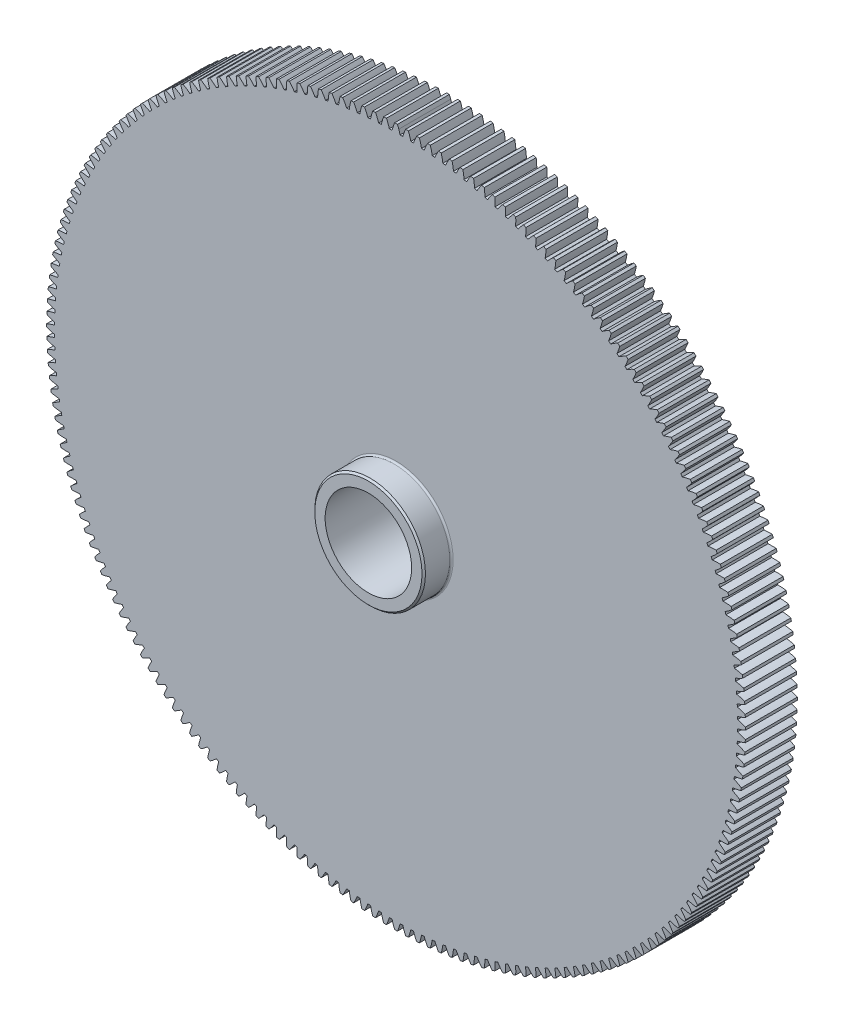
from build123d import *

# Parameters (mm, degrees)
AUFSATZ_LINEAR_AUSTRAGEN1_DEPTH = 15
SKIZZE2_R                       = 12.5
SCHNITT_LINEAR_AUSTRAGEN1_DEPTH = 144.621029098
AUFSATZ_LINEAR_START            = 8
SKIZZE5_R                       = 16
SKIZZE5_R_2                     = 12.5
AUFSATZ_LINEAR_AUSTRAGEN2_DEPTH = 8
VERRUNDUNG1_R                   = 0.5
FASE1_SIZE                      = 0.5


with BuildPart() as part:
    # Skizze1 → Aufsatz-Linear austragen1 (new body)
    with BuildSketch(Plane.XY.offset(15)):
        with BuildLine():
            ThreePointArc((-1.93882713, 98.730964998), (-2.314343681, 99.862573222), (-2.776032862, 100.961842503))
            ThreePointArc((-2.776032862, 100.961842503), (-3.172486667, 100.950162597), (-3.568891548, 100.936925915))
            ThreePointArc((-3.568891548, 100.936925915), (-3.960646001, 99.810836087), (-4.264367288, 98.657881954))
            ThreePointArc((-4.264367288, 98.657881954), (-4.651762008, 98.640375152), (-5.039084991, 98.621347194))
            ThreePointArc((-5.039084991, 98.621347194), (-5.449960921, 99.740601778), (-5.945951169, 100.824826629))
            ThreePointArc((-5.945951169, 100.824826629), (-6.341842472, 100.800699571), (-6.737635977, 100.775018042))
            ThreePointArc((-6.737635977, 100.775018042), (-7.093825787, 99.637178567), (-7.361182041, 98.475253231))
            ThreePointArc((-7.361182041, 98.475253231), (-7.747835703, 98.445586706), (-8.134369884, 98.414402028))
            ThreePointArc((-8.134369884, 98.414402028), (-8.580199707, 99.520198403), (-9.110001539, 100.588308823))
            ThreePointArc((-9.110001539, 100.588308823), (-9.504939645, 100.551758425), (-9.899731173, 100.513657394))
            ThreePointArc((-9.899731173, 100.513657394), (-10.220004824, 99.365191181), (-10.450732197, 98.195441323))
            ThreePointArc((-10.450732197, 98.195441323), (-10.83626322, 98.153644351), (-11.221627135, 98.110333729))
            ThreePointArc((-11.221627135, 98.110333729), (-11.701970872, 99.201580606), (-12.265061438, 100.252522502))
            ThreePointArc((-12.265061438, 100.252522502), (-12.65865659, 100.203584833), (-13.05205653, 100.153101901))
            ThreePointArc((-13.05205653, 100.153101901), (-13.336097949, 98.995142348), (-13.529968741, 97.818722369))
            ThreePointArc((-13.529968741, 97.818722369), (-13.913996654, 97.764836199), (-14.297809996, 97.709442375))
            ThreePointArc((-14.297809996, 97.709442375), (-14.812193604, 98.785062827), (-15.408017202, 99.817799044))
            ThreePointArc((-15.408017202, 99.817799044), (-15.799880969, 99.7565224), (-16.191501083, 99.693707388))
            ThreePointArc((-16.191501083, 99.693707388), (-16.439029956, 98.527397262), (-16.59585284, 97.345468146))
            ThreePointArc((-16.59585284, 97.345468146), (-16.977998653, 97.279545958), (-17.359882644, 97.212123599))
            ThreePointArc((-17.359882644, 97.212123599), (-17.90779849, 98.271056117), (-18.535767113, 99.284567469))
            ThreePointArc((-18.535767113, 99.284567469), (-18.925512773, 99.211012324), (-19.314966579, 99.135927221))
            ThreePointArc((-19.314966579, 99.135927221), (-19.525738625, 97.96241753), (-19.645358836, 96.776145698))
            ThreePointArc((-19.645358836, 96.776145698), (-20.025245416, 96.698252549), (-20.404823183, 96.618868193))
            ThreePointArc((-20.404823183, 96.618868193), (-20.98573054, 97.660067739), (-21.64522446, 98.653354013))
            ThreePointArc((-21.64522446, 98.653354013), (-22.032467381, 98.567592956), (-22.419370535, 98.480311864))
            ThreePointArc((-22.419370535, 98.480311864), (-22.593177748, 97.300760718), (-22.675477234, 96.111316879))
            ThreePointArc((-22.675477234, 96.111316879), (-23.052729681, 96.021529639), (-23.429626626, 95.930261629))
            ThreePointArc((-23.429626626, 95.930261629), (-24.042952208, 96.952700665), (-24.733320583, 97.924781608))
            ThreePointArc((-24.733320583, 97.924781608), (-25.117678604, 97.826899274), (-25.501649279, 97.727508328))
            ThreePointArc((-25.501649279, 97.727508328), (-25.638320131, 96.543079803), (-25.683217674, 95.351637793))
            ThreePointArc((-25.683217674, 95.351637793), (-26.057463684, 95.250045073), (-26.431307856, 95.146983478))
            ThreePointArc((-26.431307856, 95.146983478), (-27.076446385, 96.14965298), (-27.797007905, 97.099569265))
            ThreePointArc((-27.797007905, 97.099569265), (-28.17810171, 96.989662253), (-28.558760973, 96.878259541))
            ThreePointArc((-28.558760973, 96.878259541), (-28.658160588, 95.690122525), (-28.665611879, 94.497858153))
            ThreePointArc((-28.665611879, 94.497858153), (-29.036482117, 94.384560211), (-29.406904576, 94.269806742))
            ThreePointArc((-29.406904576, 94.269806742), (-30.083219379, 95.251717197), (-30.833262937, 96.178531371))
            ThreePointArc((-30.833262937, 96.178531371), (-31.210716432, 96.056708146), (-31.587688619, 95.933403607))
            ThreePointArc((-31.587688619, 95.933403607), (-31.649718901, 94.742730648), (-31.619716586, 93.550820536))
            ThreePointArc((-31.619716586, 93.550820536), (-31.986845047, 93.425929184), (-32.353480232, 93.299597088))
            ThreePointArc((-32.353480232, 93.299597088), (-33.060303867, 94.259779468), (-33.83908926, 95.162576878))
            ThreePointArc((-33.83908926, 95.162576878), (-34.212529945, 95.028957664), (-34.58544303, 94.893872987))
            ThreePointArc((-34.58544303, 94.893872987), (-34.610042762, 93.701839134), (-34.54261645, 92.511459554))
            ThreePointArc((-34.54261645, 92.511459554), (-34.905640823, 92.375098044), (-35.268126908, 92.237311996))
            ThreePointArc((-35.268126908, 92.237311996), (-36.004761826, 93.174818717), (-36.811520488, 94.05270841))
            ThreePointArc((-36.811520488, 94.05270841), (-37.180579821, 93.907425075), (-37.549065784, 93.76069357))
            ThreePointArc((-37.549065784, 93.76069357), (-37.536210689, 92.568475218), (-37.431426922, 91.38080093))
            ThreePointArc((-37.431426922, 91.38080093), (-37.789988946, 91.233103835), (-38.147968202, 91.083999813))
            ThreePointArc((-38.147968202, 91.083999813), (-38.913687432, 91.997905669), (-39.747623189, 92.850021275))
            ThreePointArc((-39.747623189, 92.850021275), (-40.111936954, 92.693217194), (-40.475632143, 92.534983669))
            ThreePointArc((-40.475632143, 92.534983669), (-40.425334908, 91.343757393), (-40.283297094, 90.159960488))
            ThreePointArc((-40.283297094, 90.159960488), (-40.637042912, 90.001073567), (-40.990162056, 89.840798719))
            ThreePointArc((-40.990162056, 89.840798719), (-41.784209927, 90.730201795), (-42.644499785, 91.555702379))
            ThreePointArc((-42.644499785, 91.555702379), (-43.003708448, 91.387532299), (-43.36225394, 91.21795291))
            ThreePointArc((-43.36225394, 91.21795291), (-43.274564203, 90.028894307), (-43.095412516, 88.85014305))
            ThreePointArc((-43.095412516, 88.85014305), (-43.443993023, 88.680223106), (-43.79190357, 88.508935604))
            ThreePointArc((-43.79190357, 88.508935604), (-44.613496452, 89.372958166), (-45.499291408, 90.171029057))
            ThreePointArc((-45.499291408, 90.171029057), (-45.853040474, 89.991658943), (-46.206082428, 89.810901045))
            ThreePointArc((-46.206082428, 89.810901045), (-46.081086727, 88.625183572), (-45.864997969, 87.452641248))
            ThreePointArc((-45.864997969, 87.452641248), (-46.208069158, 87.271855971), (-46.550427761, 87.089724854))
            ThreePointArc((-46.550427761, 87.089724854), (-47.398754841, 87.927514218), (-48.309180724, 88.697367817))
            ThreePointArc((-48.309180724, 88.697367817), (-48.657121084, 88.506974684), (-49.004311091, 88.315216664))
            ThreePointArc((-49.004311091, 88.315216664), (-48.842132781, 87.13401048), (-48.589320206, 85.968834247))
            ThreePointArc((-48.589320206, 85.968834247), (-48.926543507, 85.77736205), (-49.263012301, 85.584567061))
            ThreePointArc((-49.263012301, 85.584567061), (-50.137236382, 86.395296428), (-51.071394711, 87.136172983))
            ThreePointArc((-51.071394711, 87.136172983), (-51.413182991, 86.934944727), (-51.754178415, 86.732375826))
            ThreePointArc((-51.754178415, 86.732375826), (-51.554977548, 85.55684664), (-51.265690651, 84.400186386))
            ThreePointArc((-51.265690651, 84.400186386), (-51.596733265, 84.19821623), (-51.926980195, 83.994947632))
            ThreePointArc((-51.926980195, 83.994947632), (-52.826238524, 84.777816912), (-53.783207397, 85.488985267))
            ThreePointArc((-53.783207397, 85.488985267), (-54.118506293, 85.277120475), (-54.452970614, 85.063940605))
            ThreePointArc((-54.452970614, 85.063940605), (-54.216943776, 83.895248522), (-53.891468048, 82.748245731))
            ThreePointArc((-53.891468048, 82.748245731), (-54.216003277, 82.535976935), (-54.539702429, 82.322435331))
            ThreePointArc((-54.539702429, 82.322435331), (-55.463107547, 83.076671926), (-56.441942551, 83.757430243))
            ThreePointArc((-56.441942551, 83.757430243), (-56.770421163, 83.535138001), (-57.098024304, 83.311557544))
            ThreePointArc((-57.098024304, 83.311557544), (-56.825404426, 82.150855922), (-56.464061072, 81.014642548))
            ThreePointArc((-56.464061072, 81.014642548), (-56.781768639, 80.792284595), (-57.098600561, 80.568680726))
            ThreePointArc((-57.098600561, 80.568680726), (-58.045241178, 81.293540294), (-59.044976322, 81.943216748))
            ThreePointArc((-59.044976322, 81.943216748), (-59.366310481, 81.710716431), (-59.686729139, 81.476956034))
            ThreePointArc((-59.686729139, 81.476956034), (-59.377785263, 80.325390346), (-58.980930885, 79.201087693))
            ThreePointArc((-58.980930885, 79.201087693), (-59.291497251, 78.968860025), (-59.601149268, 78.73541456))
            ThreePointArc((-59.601149268, 78.73541456), (-60.570091164, 79.430181753), (-61.58973983, 80.048135191))
            ThreePointArc((-61.58973983, 80.048135191), (-61.903612419, 79.805656249), (-62.216530377, 79.561946606))
            ThreePointArc((-62.216530377, 79.561946606), (-61.871567394, 78.420653307), (-61.439593641, 77.309370927))
            ThreePointArc((-61.439593641, 77.309370927), (-61.742712313, 77.067502724), (-62.044878836, 76.824446045))
            ThreePointArc((-62.044878836, 76.824446045), (-63.035165783, 77.488435212), (-64.0737217, 78.074055789))
            ThreePointArc((-64.0737217, 78.074055789), (-64.379822964, 77.82183752), (-64.684931412, 77.568419141))
            ThreePointArc((-64.684931412, 77.568419141), (-64.304289758, 76.438524552), (-63.837622935, 75.341359146))
            ThreePointArc((-63.837622935, 75.341359146), (-64.132994772, 75.090089102), (-64.427377599, 74.837661077))
            ThreePointArc((-64.427377599, 74.837661077), (-65.438032304, 75.470216941), (-66.494470543, 76.02292672))
            ThreePointArc((-66.494470543, 76.02292672), (-66.792498397, 75.761218032), (-67.089496228, 75.498341012))
            ThreePointArc((-67.089496228, 75.498341012), (-66.673551552, 74.380960201), (-66.172652202, 73.298994539))
            ThreePointArc((-66.172652202, 73.298994539), (-66.459985709, 73.038570628), (-66.74629432, 72.777020373))
            ThreePointArc((-66.74629432, 72.777020373), (-67.776319387, 73.377518678), (-68.849597371, 73.8967722))
            ThreePointArc((-68.849597371, 73.8967722), (-69.139257698, 73.625831369), (-69.427851812, 73.353755136))
            ThreePointArc((-69.427851812, 73.353755136), (-68.9770146, 72.249990822), (-68.442377051, 71.184292674))
            ThreePointArc((-68.442377051, 71.184292674), (-68.721388663, 70.914971903), (-68.999340506, 70.644557537))
            ThreePointArc((-68.999340506, 70.644557537), (-70.047719426, 71.212405662), (-71.136777959, 71.697690488))
            ThreePointArc((-71.136777959, 71.697690488), (-71.417784899, 71.417784899), (-71.697690488, 71.136777959))
            ThreePointArc((-71.697690488, 71.136777959), (-71.212405662, 70.047719425), (-70.644557536, 68.999340506))
            ThreePointArc((-70.644557536, 68.999340506), (-70.914971903, 68.721388663), (-71.184292674, 68.442377051))
            ThreePointArc((-71.184292674, 68.442377051), (-72.249990822, 68.9770146), (-73.353755136, 69.427851812))
            ThreePointArc((-73.353755136, 69.427851812), (-73.625831369, 69.139257698), (-73.8967722, 68.849597371))
            ThreePointArc((-73.8967722, 68.849597371), (-73.377518678, 67.776319387), (-72.777020373, 66.74629432))
            ThreePointArc((-72.777020373, 66.74629432), (-73.038570628, 66.459985708), (-73.298994539, 66.172652202))
            ThreePointArc((-73.298994539, 66.172652202), (-74.3809602, 66.673551552), (-75.498341012, 67.089496228))
            ThreePointArc((-75.498341012, 67.089496228), (-75.761218032, 66.792498397), (-76.02292672, 66.494470543))
            ThreePointArc((-76.02292672, 66.494470543), (-75.470216941, 65.438032304), (-74.837661077, 64.427377599))
            ThreePointArc((-74.837661077, 64.427377599), (-75.090089102, 64.132994772), (-75.341359145, 63.837622934))
            ThreePointArc((-75.341359145, 63.837622934), (-76.438524551, 64.304289758), (-77.568419141, 64.684931411))
            ThreePointArc((-77.568419141, 64.684931411), (-77.821837519, 64.379822964), (-78.074055789, 64.0737217))
            ThreePointArc((-78.074055789, 64.0737217), (-77.488435212, 63.035165783), (-76.824446044, 62.044878835))
            ThreePointArc((-76.824446044, 62.044878835), (-77.067502724, 61.742712312), (-77.309370927, 61.43959364))
            ThreePointArc((-77.309370927, 61.43959364), (-78.420653307, 61.871567394), (-79.561946605, 62.216530377))
            ThreePointArc((-79.561946605, 62.216530377), (-79.805656249, 61.903612418), (-80.048135191, 61.589739829))
            ThreePointArc((-80.048135191, 61.589739829), (-79.430181753, 60.570091164), (-78.735414559, 59.601149267))
            ThreePointArc((-78.735414559, 59.601149267), (-78.968860025, 59.29149725), (-79.201087693, 58.980930885))
            ThreePointArc((-79.201087693, 58.980930885), (-80.325390346, 59.377785262), (-81.476956034, 59.686729138))
            ThreePointArc((-81.476956034, 59.686729138), (-81.710716431, 59.366310481), (-81.943216747, 59.044976321))
            ThreePointArc((-81.943216747, 59.044976321), (-81.293540294, 58.045241178), (-80.568680725, 57.09860056))
            ThreePointArc((-80.568680725, 57.09860056), (-80.792284595, 56.781768638), (-81.014642547, 56.464061072))
            ThreePointArc((-81.014642547, 56.464061072), (-82.150855922, 56.825404426), (-83.311557543, 57.098024304))
            ThreePointArc((-83.311557543, 57.098024304), (-83.535138, 56.770421162), (-83.757430242, 56.44194255))
            ThreePointArc((-83.757430242, 56.44194255), (-83.076671925, 55.463107546), (-82.322435331, 54.539702428))
            ThreePointArc((-82.322435331, 54.539702428), (-82.535976934, 54.216003276), (-82.74824573, 53.891468047))
            ThreePointArc((-82.74824573, 53.891468047), (-83.895248521, 54.216943775), (-85.063940604, 54.452970613))
            ThreePointArc((-85.063940604, 54.452970613), (-85.277120474, 54.118506292), (-85.488985266, 53.783207397))
            ThreePointArc((-85.488985266, 53.783207397), (-84.777816911, 52.826238524), (-83.994947631, 51.926980194))
            ThreePointArc((-83.994947631, 51.926980194), (-84.198216229, 51.596733265), (-84.400186385, 51.26569065))
            ThreePointArc((-84.400186385, 51.26569065), (-85.556846639, 51.554977547), (-86.732375825, 51.754178415))
            ThreePointArc((-86.732375825, 51.754178415), (-86.934944726, 51.41318299), (-87.136172982, 51.07139471))
            ThreePointArc((-87.136172982, 51.07139471), (-86.395296427, 50.137236382), (-85.58456706, 49.2630123))
            ThreePointArc((-85.58456706, 49.2630123), (-85.777362049, 48.926543507), (-85.968834246, 48.589320206))
            ThreePointArc((-85.968834246, 48.589320206), (-87.134010479, 48.842132781), (-88.315216663, 49.00431109))
            ThreePointArc((-88.315216663, 49.00431109), (-88.506974683, 48.657121083), (-88.697367816, 48.309180723))
            ThreePointArc((-88.697367816, 48.309180723), (-87.927514217, 47.398754841), (-87.089724853, 46.550427761))
            ThreePointArc((-87.089724853, 46.550427761), (-87.27185597, 46.208069157), (-87.452641247, 45.864997968))
            ThreePointArc((-87.452641247, 45.864997968), (-88.62518357, 46.081086726), (-89.810901044, 46.206082428))
            ThreePointArc((-89.810901044, 46.206082428), (-89.991658941, 45.853040473), (-90.171029056, 45.499291408))
            ThreePointArc((-90.171029056, 45.499291408), (-89.372958165, 44.613496451), (-88.508935602, 43.791903569))
            ThreePointArc((-88.508935602, 43.791903569), (-88.680223105, 43.443993022), (-88.850143048, 43.095412516))
            ThreePointArc((-88.850143048, 43.095412516), (-90.028894305, 43.274564202), (-91.217952909, 43.36225394))
            ThreePointArc((-91.217952909, 43.36225394), (-91.387532297, 43.003708447), (-91.555702377, 42.644499784))
            ThreePointArc((-91.555702377, 42.644499784), (-90.730201794, 41.784209926), (-89.840798718, 40.990162056))
            ThreePointArc((-89.840798718, 40.990162056), (-90.001073566, 40.637042911), (-90.159960486, 40.283297094))
            ThreePointArc((-90.159960486, 40.283297094), (-91.343757391, 40.425334908), (-92.534983667, 40.475632143))
            ThreePointArc((-92.534983667, 40.475632143), (-92.693217192, 40.111936953), (-92.850021273, 39.747623188))
            ThreePointArc((-92.850021273, 39.747623188), (-91.997905667, 38.913687432), (-91.083999812, 38.147968201))
            ThreePointArc((-91.083999812, 38.147968201), (-91.233103834, 37.789988945), (-91.380800928, 37.431426921))
            ThreePointArc((-91.380800928, 37.431426921), (-92.568475216, 37.536210688), (-93.760693568, 37.549065783))
            ThreePointArc((-93.760693568, 37.549065783), (-93.907425073, 37.18057982), (-94.052708409, 36.811520487))
            ThreePointArc((-94.052708409, 36.811520487), (-93.174818715, 36.004761825), (-92.237311995, 35.268126908))
            ThreePointArc((-92.237311995, 35.268126908), (-92.375098042, 34.905640822), (-92.511459552, 34.542616449))
            ThreePointArc((-92.511459552, 34.542616449), (-93.701839132, 34.610042761), (-94.893872985, 34.585443029))
            ThreePointArc((-94.893872985, 34.585443029), (-95.028957662, 34.212529944), (-95.162576876, 33.839089259))
            ThreePointArc((-95.162576876, 33.839089259), (-94.259779466, 33.060303866), (-93.299597086, 32.353480231))
            ThreePointArc((-93.299597086, 32.353480231), (-93.425929182, 31.986845046), (-93.550820534, 31.619716585))
            ThreePointArc((-93.550820534, 31.619716585), (-94.742730646, 31.6497189), (-95.933403605, 31.587688618))
            ThreePointArc((-95.933403605, 31.587688618), (-96.056708144, 31.210716431), (-96.178531369, 30.833262936))
            ThreePointArc((-96.178531369, 30.833262936), (-95.251717194, 30.083219378), (-94.26980674, 29.406904575))
            ThreePointArc((-94.26980674, 29.406904575), (-94.384560209, 29.036482116), (-94.497858151, 28.665611878))
            ThreePointArc((-94.497858151, 28.665611878), (-95.690122522, 28.658160588), (-96.878259538, 28.558760973))
            ThreePointArc((-96.878259538, 28.558760973), (-96.989662251, 28.178101709), (-97.099569263, 27.797007905))
            ThreePointArc((-97.099569263, 27.797007905), (-96.149652978, 27.076446385), (-95.146983476, 26.431307855))
            ThreePointArc((-95.146983476, 26.431307855), (-95.25004507, 26.057463683), (-95.351637791, 25.683217673))
            ThreePointArc((-95.351637791, 25.683217673), (-96.543079801, 25.638320131), (-97.727508326, 25.501649278))
            ThreePointArc((-97.727508326, 25.501649278), (-97.826899271, 25.117678603), (-97.924781605, 24.733320582))
            ThreePointArc((-97.924781605, 24.733320582), (-96.952700662, 24.042952208), (-95.930261626, 23.429626625))
            ThreePointArc((-95.930261626, 23.429626625), (-96.021529637, 23.05272968), (-96.111316876, 22.675477233))
            ThreePointArc((-96.111316876, 22.675477233), (-97.300760716, 22.593177747), (-98.480311861, 22.419370534))
            ThreePointArc((-98.480311861, 22.419370534), (-98.567592953, 22.03246738), (-98.653354011, 21.645224459))
            ThreePointArc((-98.653354011, 21.645224459), (-97.660067736, 20.98573054), (-96.61886819, 20.404823183))
            ThreePointArc((-96.61886819, 20.404823183), (-96.698252546, 20.025245416), (-96.776145696, 19.645358835))
            ThreePointArc((-96.776145696, 19.645358835), (-97.962417527, 19.525738625), (-99.135927219, 19.314966578))
            ThreePointArc((-99.135927219, 19.314966578), (-99.211012321, 18.925512773), (-99.284567466, 18.535767112))
            ThreePointArc((-99.284567466, 18.535767112), (-98.271056114, 17.907798489), (-97.212123596, 17.359882643))
            ThreePointArc((-97.212123596, 17.359882643), (-97.279545955, 16.977998652), (-97.345468143, 16.595852839))
            ThreePointArc((-97.345468143, 16.595852839), (-98.527397259, 16.439029956), (-99.693707385, 16.191501082))
            ThreePointArc((-99.693707385, 16.191501082), (-99.756522397, 15.799880969), (-99.817799041, 15.408017201))
            ThreePointArc((-99.817799041, 15.408017201), (-98.785062824, 14.812193604), (-97.709442373, 14.297809995))
            ThreePointArc((-97.709442373, 14.297809995), (-97.764836197, 13.913996653), (-97.818722366, 13.529968741))
            ThreePointArc((-97.818722366, 13.529968741), (-98.995142345, 13.336097949), (-100.153101898, 13.05205653))
            ThreePointArc((-100.153101898, 13.05205653), (-100.20358483, 12.65865659), (-100.252522499, 12.265061437))
            ThreePointArc((-100.252522499, 12.265061437), (-99.201580603, 11.701970871), (-98.110333726, 11.221627135))
            ThreePointArc((-98.110333726, 11.221627135), (-98.153644348, 10.83626322), (-98.19544132, 10.450732196))
            ThreePointArc((-98.19544132, 10.450732196), (-99.365191178, 10.220004823), (-100.513657391, 9.899731173))
            ThreePointArc((-100.513657391, 9.899731173), (-100.551758422, 9.504939645), (-100.58830882, 9.110001539))
            ThreePointArc((-100.58830882, 9.110001539), (-99.520198399, 8.580199707), (-98.414402025, 8.134369884))
            ThreePointArc((-98.414402025, 8.134369884), (-98.445586703, 7.747835703), (-98.475253228, 7.361182041))
            ThreePointArc((-98.475253228, 7.361182041), (-99.637178564, 7.093825787), (-100.775018039, 6.737635977))
            ThreePointArc((-100.775018039, 6.737635977), (-100.800699568, 6.341842472), (-100.824826625, 5.945951169))
            ThreePointArc((-100.824826625, 5.945951169), (-99.740601775, 5.449960921), (-98.621347191, 5.039084991))
            ThreePointArc((-98.621347191, 5.039084991), (-98.640375149, 4.651762007), (-98.657881951, 4.264367288))
            ThreePointArc((-98.657881951, 4.264367288), (-99.810836084, 3.960646001), (-100.936925911, 3.568891548))
            ThreePointArc((-100.936925911, 3.568891548), (-100.950162594, 3.172486667), (-100.961842499, 2.776032862))
            ThreePointArc((-100.961842499, 2.776032862), (-99.862573218, 2.314343681), (-98.730964994, 1.93882713))
            ThreePointArc((-98.730964994, 1.93882713), (-98.737817454, 1.551097584), (-98.743147255, 1.163344119))
            ThreePointArc((-98.743147255, 1.163344119), (-99.885992358, 0.823557536), (-100.999221224, 0.396625053))
            ThreePointArc((-100.999221224, 0.396625053), (-100.999999997, 0), (-100.999221224, -0.396625053))
            ThreePointArc((-100.999221224, -0.396625053), (-99.885992358, -0.823557536), (-98.743147255, -1.163344119))
            ThreePointArc((-98.743147255, -1.163344119), (-98.737817454, -1.551097584), (-98.730964994, -1.93882713))
            ThreePointArc((-98.730964994, -1.93882713), (-99.862573218, -2.314343681), (-100.961842499, -2.776032862))
            ThreePointArc((-100.961842499, -2.776032862), (-100.950162593, -3.172486667), (-100.936925911, -3.568891548))
            ThreePointArc((-100.936925911, -3.568891548), (-99.810836083, -3.960646001), (-98.65788195, -4.264367288))
            ThreePointArc((-98.65788195, -4.264367288), (-98.640375149, -4.651762007), (-98.621347191, -5.039084991))
            ThreePointArc((-98.621347191, -5.039084991), (-99.740601774, -5.449960921), (-100.824826625, -5.945951169))
            ThreePointArc((-100.824826625, -5.945951169), (-100.800699568, -6.341842472), (-100.775018039, -6.737635977))
            ThreePointArc((-100.775018039, -6.737635977), (-99.637178563, -7.093825787), (-98.475253227, -7.361182041))
            ThreePointArc((-98.475253227, -7.361182041), (-98.445586702, -7.747835703), (-98.414402025, -8.134369884))
            ThreePointArc((-98.414402025, -8.134369884), (-99.520198399, -8.580199707), (-100.58830882, -9.110001539))
            ThreePointArc((-100.58830882, -9.110001539), (-100.551758421, -9.504939645), (-100.51365739, -9.899731173))
            ThreePointArc((-100.51365739, -9.899731173), (-99.365191178, -10.220004823), (-98.195441319, -10.450732196))
            ThreePointArc((-98.195441319, -10.450732196), (-98.153644347, -10.83626322), (-98.110333725, -11.221627135))
            ThreePointArc((-98.110333725, -11.221627135), (-99.201580603, -11.701970871), (-100.252522498, -12.265061437))
            ThreePointArc((-100.252522498, -12.265061437), (-100.203584829, -12.65865659), (-100.153101897, -13.05205653))
            ThreePointArc((-100.153101897, -13.05205653), (-98.995142345, -13.336097949), (-97.818722365, -13.529968741))
            ThreePointArc((-97.818722365, -13.529968741), (-97.764836196, -13.913996653), (-97.709442372, -14.297809995))
            ThreePointArc((-97.709442372, -14.297809995), (-98.785062823, -14.812193603), (-99.81779904, -15.408017201))
            ThreePointArc((-99.81779904, -15.408017201), (-99.756522396, -15.799880968), (-99.693707384, -16.191501082))
            ThreePointArc((-99.693707384, -16.191501082), (-98.527397258, -16.439029955), (-97.345468142, -16.595852839))
            ThreePointArc((-97.345468142, -16.595852839), (-97.279545954, -16.977998652), (-97.212123595, -17.359882643))
            ThreePointArc((-97.212123595, -17.359882643), (-98.271056113, -17.907798489), (-99.284567465, -18.535767112))
            ThreePointArc((-99.284567465, -18.535767112), (-99.21101232, -18.925512772), (-99.135927217, -19.314966578))
            ThreePointArc((-99.135927217, -19.314966578), (-97.962417526, -19.525738624), (-96.776145694, -19.645358835))
            ThreePointArc((-96.776145694, -19.645358835), (-96.698252545, -20.025245416), (-96.618868189, -20.404823182))
            ThreePointArc((-96.618868189, -20.404823182), (-97.660067735, -20.985730539), (-98.653354009, -21.645224459))
            ThreePointArc((-98.653354009, -21.645224459), (-98.567592952, -22.03246738), (-98.48031186, -22.419370534))
            ThreePointArc((-98.48031186, -22.419370534), (-97.300760714, -22.593177747), (-96.111316875, -22.675477233))
            ThreePointArc((-96.111316875, -22.675477233), (-96.021529635, -23.05272968), (-95.930261625, -23.429626625))
            ThreePointArc((-95.930261625, -23.429626625), (-96.952700661, -24.042952207), (-97.924781604, -24.733320582))
            ThreePointArc((-97.924781604, -24.733320582), (-97.82689927, -25.117678603), (-97.727508324, -25.501649277))
            ThreePointArc((-97.727508324, -25.501649277), (-96.543079799, -25.63832013), (-95.351637789, -25.683217673))
            ThreePointArc((-95.351637789, -25.683217673), (-95.250045068, -26.057463683), (-95.146983474, -26.431307855))
            ThreePointArc((-95.146983474, -26.431307855), (-96.149652976, -27.076446384), (-97.099569261, -27.797007904))
            ThreePointArc((-97.099569261, -27.797007904), (-96.989662249, -28.178101709), (-96.878259537, -28.558760972))
            ThreePointArc((-96.878259537, -28.558760972), (-95.69012252, -28.658160587), (-94.497858149, -28.665611878))
            ThreePointArc((-94.497858149, -28.665611878), (-94.384560207, -29.036482115), (-94.269806738, -29.406904575))
            ThreePointArc((-94.269806738, -29.406904575), (-95.251717192, -30.083219377), (-96.178531367, -30.833262935))
            ThreePointArc((-96.178531367, -30.833262935), (-96.056708141, -31.21071643), (-95.933403603, -31.587688618))
            ThreePointArc((-95.933403603, -31.587688618), (-94.742730643, -31.649718899), (-93.550820532, -31.619716584))
            ThreePointArc((-93.550820532, -31.619716584), (-93.42592918, -31.986845046), (-93.299597084, -32.35348023))
            ThreePointArc((-93.299597084, -32.35348023), (-94.259779464, -33.060303865), (-95.162576874, -33.839089258))
            ThreePointArc((-95.162576874, -33.839089258), (-95.02895766, -34.212529943), (-94.893872982, -34.585443028))
            ThreePointArc((-94.893872982, -34.585443028), (-93.70183913, -34.61004276), (-92.51145955, -34.542616448))
            ThreePointArc((-92.51145955, -34.542616448), (-92.37509804, -34.905640822), (-92.237311992, -35.268126907))
            ThreePointArc((-92.237311992, -35.268126907), (-93.174818713, -36.004761824), (-94.052708406, -36.811520486))
            ThreePointArc((-94.052708406, -36.811520486), (-93.90742507, -37.180579819), (-93.760693566, -37.549065782))
            ThreePointArc((-93.760693566, -37.549065782), (-92.568475214, -37.536210687), (-91.380800925, -37.43142692))
            ThreePointArc((-91.380800925, -37.43142692), (-91.233103831, -37.789988944), (-91.083999809, -38.1479682))
            ThreePointArc((-91.083999809, -38.1479682), (-91.997905665, -38.91368743), (-92.850021271, -39.747623187))
            ThreePointArc((-92.850021271, -39.747623187), (-92.69321719, -40.111936952), (-92.534983664, -40.475632141))
            ThreePointArc((-92.534983664, -40.475632141), (-91.343757388, -40.425334907), (-90.159960483, -40.283297092))
            ThreePointArc((-90.159960483, -40.283297092), (-90.001073563, -40.63704291), (-89.840798715, -40.990162054))
            ThreePointArc((-89.840798715, -40.990162054), (-90.730201791, -41.784209925), (-91.555702374, -42.644499783))
            ThreePointArc((-91.555702374, -42.644499783), (-91.387532295, -43.003708446), (-91.217952906, -43.362253938))
            ThreePointArc((-91.217952906, -43.362253938), (-90.028894303, -43.274564201), (-88.850143046, -43.095412514))
            ThreePointArc((-88.850143046, -43.095412514), (-88.680223102, -43.443993021), (-88.508935599, -43.791903568))
            ThreePointArc((-88.508935599, -43.791903568), (-89.372958162, -44.613496449), (-90.171029053, -45.499291406))
            ThreePointArc((-90.171029053, -45.499291406), (-89.991658938, -45.853040471), (-89.810901041, -46.206082426))
            ThreePointArc((-89.810901041, -46.206082426), (-88.625183567, -46.081086724), (-87.452641244, -45.864997967))
            ThreePointArc((-87.452641244, -45.864997967), (-87.271855967, -46.208069156), (-87.08972485, -46.550427759))
            ThreePointArc((-87.08972485, -46.550427759), (-87.927514214, -47.398754839), (-88.697367813, -48.309180722))
            ThreePointArc((-88.697367813, -48.309180722), (-88.50697468, -48.657121082), (-88.31521666, -49.004311089))
            ThreePointArc((-88.31521666, -49.004311089), (-87.134010476, -48.842132779), (-85.968834243, -48.589320204))
            ThreePointArc((-85.968834243, -48.589320204), (-85.777362046, -48.926543505), (-85.584567056, -49.263012298))
            ThreePointArc((-85.584567056, -49.263012298), (-86.395296424, -50.13723638), (-87.136172979, -51.071394708))
            ThreePointArc((-87.136172979, -51.071394708), (-86.934944723, -51.413182988), (-86.732375822, -51.754178413))
            ThreePointArc((-86.732375822, -51.754178413), (-85.556846636, -51.554977546), (-84.400186382, -51.265690648))
            ThreePointArc((-84.400186382, -51.265690648), (-84.198216225, -51.596733263), (-83.994947628, -51.926980192))
            ThreePointArc((-83.994947628, -51.926980192), (-84.777816908, -52.826238522), (-85.488985263, -53.783207395))
            ThreePointArc((-85.488985263, -53.783207395), (-85.277120471, -54.11850629), (-85.063940601, -54.452970611))
            ThreePointArc((-85.063940601, -54.452970611), (-83.895248518, -54.216943773), (-82.748245727, -53.891468045))
            ThreePointArc((-82.748245727, -53.891468045), (-82.535976931, -54.216003274), (-82.322435327, -54.539702426))
            ThreePointArc((-82.322435327, -54.539702426), (-83.076671922, -55.463107544), (-83.757430239, -56.441942548))
            ThreePointArc((-83.757430239, -56.441942548), (-83.535137997, -56.77042116), (-83.31155754, -57.098024302))
            ThreePointArc((-83.31155754, -57.098024302), (-82.150855918, -56.825404423), (-81.014642544, -56.464061069))
            ThreePointArc((-81.014642544, -56.464061069), (-80.792284591, -56.781768636), (-80.568680722, -57.098600558))
            ThreePointArc((-80.568680722, -57.098600558), (-81.29354029, -58.045241175), (-81.943216744, -59.044976319))
            ThreePointArc((-81.943216744, -59.044976319), (-81.710716427, -59.366310478), (-81.47695603, -59.686729136))
            ThreePointArc((-81.47695603, -59.686729136), (-80.325390342, -59.37778526), (-79.201087689, -58.980930882))
            ThreePointArc((-79.201087689, -58.980930882), (-78.968860021, -59.291497248), (-78.735414556, -59.601149264))
            ThreePointArc((-78.735414556, -59.601149264), (-79.430181749, -60.570091161), (-80.048135187, -61.589739827))
            ThreePointArc((-80.048135187, -61.589739827), (-79.805656245, -61.903612415), (-79.561946602, -62.216530374))
            ThreePointArc((-79.561946602, -62.216530374), (-78.420653303, -61.871567391), (-77.309370923, -61.439593637))
            ThreePointArc((-77.309370923, -61.439593637), (-77.06750272, -61.74271231), (-76.824446041, -62.044878833))
            ThreePointArc((-76.824446041, -62.044878833), (-77.488435208, -63.03516578), (-78.074055785, -64.073721697))
            ThreePointArc((-78.074055785, -64.073721697), (-77.821837516, -64.379822961), (-77.568419138, -64.684931408))
            ThreePointArc((-77.568419138, -64.684931408), (-76.438524548, -64.304289755), (-75.341359142, -63.837622931))
            ThreePointArc((-75.341359142, -63.837622931), (-75.090089099, -64.132994769), (-74.837661073, -64.427377596))
            ThreePointArc((-74.837661073, -64.427377596), (-75.470216937, -65.4380323), (-76.022926716, -66.49447054))
            ThreePointArc((-76.022926716, -66.49447054), (-75.761218028, -66.792498394), (-75.498341009, -67.089496225))
            ThreePointArc((-75.498341009, -67.089496225), (-74.380960197, -66.673551549), (-73.298994535, -66.172652199))
            ThreePointArc((-73.298994535, -66.172652199), (-73.038570625, -66.459985705), (-72.777020369, -66.746294316))
            ThreePointArc((-72.777020369, -66.746294316), (-73.377518674, -67.776319383), (-73.896772197, -68.849597368))
            ThreePointArc((-73.896772197, -68.849597368), (-73.625831365, -69.139257695), (-73.353755132, -69.427851809))
            ThreePointArc((-73.353755132, -69.427851809), (-72.249990818, -68.977014596), (-71.18429267, -68.442377047))
            ThreePointArc((-71.18429267, -68.442377047), (-70.9149719, -68.721388659), (-70.644557533, -68.999340503))
            ThreePointArc((-70.644557533, -68.999340503), (-71.212405659, -70.047719422), (-71.697690485, -71.136777956))
            ThreePointArc((-71.697690485, -71.136777956), (-71.417784896, -71.417784896), (-71.136777956, -71.697690485))
            ThreePointArc((-71.136777956, -71.697690485), (-70.047719422, -71.212405659), (-68.999340503, -70.644557533))
            ThreePointArc((-68.999340503, -70.644557533), (-68.721388659, -70.9149719), (-68.442377047, -71.18429267))
            ThreePointArc((-68.442377047, -71.18429267), (-68.977014596, -72.249990818), (-69.427851809, -73.353755132))
            ThreePointArc((-69.427851809, -73.353755132), (-69.139257695, -73.625831365), (-68.849597368, -73.896772197))
            ThreePointArc((-68.849597368, -73.896772197), (-67.776319383, -73.377518674), (-66.746294316, -72.777020369))
            ThreePointArc((-66.746294316, -72.777020369), (-66.459985705, -73.038570625), (-66.172652198, -73.298994535))
            ThreePointArc((-66.172652198, -73.298994535), (-66.673551548, -74.380960197), (-67.089496225, -75.498341008))
            ThreePointArc((-67.089496225, -75.498341008), (-66.792498394, -75.761218028), (-66.494470539, -76.022926716))
            ThreePointArc((-66.494470539, -76.022926716), (-65.4380323, -75.470216937), (-64.427377596, -74.837661073))
            ThreePointArc((-64.427377596, -74.837661073), (-64.132994769, -75.090089098), (-63.837622931, -75.341359141))
            ThreePointArc((-63.837622931, -75.341359141), (-64.304289755, -76.438524547), (-64.684931408, -77.568419137))
            ThreePointArc((-64.684931408, -77.568419137), (-64.379822961, -77.821837516), (-64.073721697, -78.074055785))
            ThreePointArc((-64.073721697, -78.074055785), (-63.03516578, -77.488435208), (-62.044878832, -76.824446041))
            ThreePointArc((-62.044878832, -76.824446041), (-61.742712309, -77.06750272), (-61.439593637, -77.309370923))
            ThreePointArc((-61.439593637, -77.309370923), (-61.871567391, -78.420653303), (-62.216530374, -79.561946601))
            ThreePointArc((-62.216530374, -79.561946601), (-61.903612415, -79.805656245), (-61.589739826, -80.048135187))
            ThreePointArc((-61.589739826, -80.048135187), (-60.570091161, -79.430181749), (-59.601149264, -78.735414555))
            ThreePointArc((-59.601149264, -78.735414555), (-59.291497247, -78.96886002), (-58.980930882, -79.201087689))
            ThreePointArc((-58.980930882, -79.201087689), (-59.377785259, -80.325390341), (-59.686729135, -81.47695603))
            ThreePointArc((-59.686729135, -81.47695603), (-59.366310478, -81.710716427), (-59.044976318, -81.943216743))
            ThreePointArc((-59.044976318, -81.943216743), (-58.045241175, -81.293540289), (-57.098600557, -80.568680721))
            ThreePointArc((-57.098600557, -80.568680721), (-56.781768636, -80.79228459), (-56.464061069, -81.014642543))
            ThreePointArc((-56.464061069, -81.014642543), (-56.825404423, -82.150855918), (-57.098024301, -83.311557539))
            ThreePointArc((-57.098024301, -83.311557539), (-56.770421159, -83.535137996), (-56.441942548, -83.757430238))
            ThreePointArc((-56.441942548, -83.757430238), (-55.463107543, -83.076671921), (-54.539702425, -82.322435326))
            ThreePointArc((-54.539702425, -82.322435326), (-54.216003274, -82.53597693), (-53.891468044, -82.748245726))
            ThreePointArc((-53.891468044, -82.748245726), (-54.216943773, -83.895248517), (-54.45297061, -85.0639406))
            ThreePointArc((-54.45297061, -85.0639406), (-54.118506289, -85.27712047), (-53.783207394, -85.488985262))
            ThreePointArc((-53.783207394, -85.488985262), (-52.826238521, -84.777816907), (-51.926980192, -83.994947627))
            ThreePointArc((-51.926980192, -83.994947627), (-51.596733262, -84.198216224), (-51.265690647, -84.400186381))
            ThreePointArc((-51.265690647, -84.400186381), (-51.554977545, -85.556846635), (-51.754178412, -86.732375821))
            ThreePointArc((-51.754178412, -86.732375821), (-51.413182987, -86.934944722), (-51.071394708, -87.136172978))
            ThreePointArc((-51.071394708, -87.136172978), (-50.137236379, -86.395296423), (-49.263012298, -85.584567055))
            ThreePointArc((-49.263012298, -85.584567055), (-48.926543504, -85.777362045), (-48.589320203, -85.968834242))
            ThreePointArc((-48.589320203, -85.968834242), (-48.842132778, -87.134010475), (-49.004311088, -88.315216659))
            ThreePointArc((-49.004311088, -88.315216659), (-48.657121081, -88.506974679), (-48.309180721, -88.697367812))
            ThreePointArc((-48.309180721, -88.697367812), (-47.398754838, -87.927514212), (-46.550427758, -87.089724848))
            ThreePointArc((-46.550427758, -87.089724848), (-46.208069155, -87.271855965), (-45.864997966, -87.452641242))
            ThreePointArc((-45.864997966, -87.452641242), (-46.081086724, -88.625183566), (-46.206082425, -89.81090104))
            ThreePointArc((-46.206082425, -89.81090104), (-45.853040471, -89.991658937), (-45.499291405, -90.171029052))
            ThreePointArc((-45.499291405, -90.171029052), (-44.613496449, -89.372958161), (-43.791903567, -88.508935598))
            ThreePointArc((-43.791903567, -88.508935598), (-43.44399302, -88.6802231), (-43.095412514, -88.850143044))
            ThreePointArc((-43.095412514, -88.850143044), (-43.2745642, -90.028894301), (-43.362253938, -91.217952904))
            ThreePointArc((-43.362253938, -91.217952904), (-43.003708445, -91.387532293), (-42.644499782, -91.555702373))
            ThreePointArc((-42.644499782, -91.555702373), (-41.784209924, -90.730201789), (-40.990162054, -89.840798713))
            ThreePointArc((-40.990162054, -89.840798713), (-40.637042909, -90.001073562), (-40.283297092, -90.159960482))
            ThreePointArc((-40.283297092, -90.159960482), (-40.425334906, -91.343757387), (-40.475632141, -92.534983663))
            ThreePointArc((-40.475632141, -92.534983663), (-40.111936951, -92.693217188), (-39.747623186, -92.850021269))
            ThreePointArc((-39.747623186, -92.850021269), (-38.91368743, -91.997905663), (-38.147968199, -91.083999807))
            ThreePointArc((-38.147968199, -91.083999807), (-37.789988943, -91.233103829), (-37.431426919, -91.380800924))
            ThreePointArc((-37.431426919, -91.380800924), (-37.536210687, -92.568475212), (-37.549065781, -93.760693564))
            ThreePointArc((-37.549065781, -93.760693564), (-37.180579819, -93.907425068), (-36.811520485, -94.052708404))
            ThreePointArc((-36.811520485, -94.052708404), (-36.004761823, -93.174818711), (-35.268126906, -92.23731199))
            ThreePointArc((-35.268126906, -92.23731199), (-34.905640821, -92.375098038), (-34.542616447, -92.511459548))
            ThreePointArc((-34.542616447, -92.511459548), (-34.61004276, -93.701839128), (-34.585443028, -94.89387298))
            ThreePointArc((-34.585443028, -94.89387298), (-34.212529942, -95.028957658), (-33.839089258, -95.162576871))
            ThreePointArc((-33.839089258, -95.162576871), (-33.060303864, -94.259779461), (-32.353480229, -93.299597082))
            ThreePointArc((-32.353480229, -93.299597082), (-31.986845045, -93.425929178), (-31.619716583, -93.55082053))
            ThreePointArc((-31.619716583, -93.55082053), (-31.649718899, -94.742730641), (-31.587688617, -95.933403601))
            ThreePointArc((-31.587688617, -95.933403601), (-31.21071643, -96.056708139), (-30.833262935, -96.178531364))
            ThreePointArc((-30.833262935, -96.178531364), (-30.083219377, -95.25171719), (-29.406904574, -94.269806736))
            ThreePointArc((-29.406904574, -94.269806736), (-29.036482115, -94.384560205), (-28.665611877, -94.497858147))
            ThreePointArc((-28.665611877, -94.497858147), (-28.658160586, -95.690122518), (-28.558760971, -96.878259534))
            ThreePointArc((-28.558760971, -96.878259534), (-28.178101708, -96.989662247), (-27.797007903, -97.099569259))
            ThreePointArc((-27.797007903, -97.099569259), (-27.076446383, -96.149652974), (-26.431307854, -95.146983472))
            ThreePointArc((-26.431307854, -95.146983472), (-26.057463682, -95.250045066), (-25.683217672, -95.351637787))
            ThreePointArc((-25.683217672, -95.351637787), (-25.63832013, -96.543079797), (-25.501649277, -97.727508322))
            ThreePointArc((-25.501649277, -97.727508322), (-25.117678602, -97.826899267), (-24.733320581, -97.924781601))
            ThreePointArc((-24.733320581, -97.924781601), (-24.042952207, -96.952700658), (-23.429626624, -95.930261622))
            ThreePointArc((-23.429626624, -95.930261622), (-23.052729679, -96.021529632), (-22.675477232, -96.111316872))
            ThreePointArc((-22.675477232, -96.111316872), (-22.593177746, -97.300760711), (-22.419370533, -98.480311857))
            ThreePointArc((-22.419370533, -98.480311857), (-22.03246738, -98.567592949), (-21.645224458, -98.653354007))
            ThreePointArc((-21.645224458, -98.653354007), (-20.985730539, -97.660067732), (-20.404823182, -96.618868186))
            ThreePointArc((-20.404823182, -96.618868186), (-20.025245415, -96.698252542), (-19.645358834, -96.776145691))
            ThreePointArc((-19.645358834, -96.776145691), (-19.525738624, -97.962417523), (-19.314966577, -99.135927215))
            ThreePointArc((-19.314966577, -99.135927215), (-18.925512772, -99.211012317), (-18.535767111, -99.284567462))
            ThreePointArc((-18.535767111, -99.284567462), (-17.907798488, -98.27105611), (-17.359882642, -97.212123592))
            ThreePointArc((-17.359882642, -97.212123592), (-16.977998651, -97.279545951), (-16.595852839, -97.345468139))
            ThreePointArc((-16.595852839, -97.345468139), (-16.439029955, -98.527397255), (-16.191501082, -99.693707381))
            ThreePointArc((-16.191501082, -99.693707381), (-15.799880968, -99.756522393), (-15.408017201, -99.817799037))
            ThreePointArc((-15.408017201, -99.817799037), (-14.812193603, -98.78506282), (-14.297809995, -97.709442368))
            ThreePointArc((-14.297809995, -97.709442368), (-13.913996653, -97.764836192), (-13.52996874, -97.818722362))
            ThreePointArc((-13.52996874, -97.818722362), (-13.336097948, -98.995142341), (-13.052056529, -100.153101894))
            ThreePointArc((-13.052056529, -100.153101894), (-12.658656589, -100.203584826), (-12.265061437, -100.252522494))
            ThreePointArc((-12.265061437, -100.252522494), (-11.701970871, -99.201580599), (-11.221627134, -98.110333722))
            ThreePointArc((-11.221627134, -98.110333722), (-10.836263219, -98.153644344), (-10.450732196, -98.195441316))
            ThreePointArc((-10.450732196, -98.195441316), (-10.220004823, -99.365191174), (-9.899731173, -100.513657387))
            ThreePointArc((-9.899731173, -100.513657387), (-9.504939644, -100.551758418), (-9.110001538, -100.588308816))
            ThreePointArc((-9.110001538, -100.588308816), (-8.580199706, -99.520198396), (-8.134369883, -98.414402021))
            ThreePointArc((-8.134369883, -98.414402021), (-7.747835703, -98.445586699), (-7.361182041, -98.475253224))
            ThreePointArc((-7.361182041, -98.475253224), (-7.093825787, -99.63717856), (-6.737635977, -100.775018035))
            ThreePointArc((-6.737635977, -100.775018035), (-6.341842472, -100.800699564), (-5.945951168, -100.824826622))
            ThreePointArc((-5.945951168, -100.824826622), (-5.44996092, -99.740601771), (-5.039084991, -98.621347187))
            ThreePointArc((-5.039084991, -98.621347187), (-4.651762007, -98.640375145), (-4.264367287, -98.657881947))
            ThreePointArc((-4.264367287, -98.657881947), (-3.960646001, -99.81083608), (-3.568891547, -100.936925908))
            ThreePointArc((-3.568891547, -100.936925908), (-3.172486667, -100.95016259), (-2.776032862, -100.961842496))
            ThreePointArc((-2.776032862, -100.961842496), (-2.314343681, -99.862573214), (-1.93882713, -98.73096499))
            ThreePointArc((-1.93882713, -98.73096499), (-1.551097584, -98.73781745), (-1.163344119, -98.743147251))
            ThreePointArc((-1.163344119, -98.743147251), (-0.823557536, -99.885992355), (-0.396625053, -100.99922122))
            ThreePointArc((-0.396625053, -100.99922122), (0, -100.999999993), (0.396625053, -100.99922122))
            ThreePointArc((0.396625053, -100.99922122), (0.823557536, -99.885992355), (1.163344119, -98.743147251))
            ThreePointArc((1.163344119, -98.743147251), (1.551097584, -98.73781745), (1.93882713, -98.73096499))
            ThreePointArc((1.93882713, -98.73096499), (2.314343681, -99.862573214), (2.776032862, -100.961842496))
            ThreePointArc((2.776032862, -100.961842496), (3.172486667, -100.95016259), (3.568891547, -100.936925908))
            ThreePointArc((3.568891547, -100.936925908), (3.960646001, -99.81083608), (4.264367287, -98.657881947))
            ThreePointArc((4.264367287, -98.657881947), (4.651762007, -98.640375145), (5.039084991, -98.621347187))
            ThreePointArc((5.039084991, -98.621347187), (5.44996092, -99.740601771), (5.945951168, -100.824826622))
            ThreePointArc((5.945951168, -100.824826622), (6.341842472, -100.800699564), (6.737635977, -100.775018035))
            ThreePointArc((6.737635977, -100.775018035), (7.093825787, -99.63717856), (7.361182041, -98.475253224))
            ThreePointArc((7.361182041, -98.475253224), (7.747835703, -98.445586699), (8.134369883, -98.414402021))
            ThreePointArc((8.134369883, -98.414402021), (8.580199706, -99.520198395), (9.110001538, -100.588308816))
            ThreePointArc((9.110001538, -100.588308816), (9.504939644, -100.551758418), (9.899731173, -100.513657387))
            ThreePointArc((9.899731173, -100.513657387), (10.220004823, -99.365191174), (10.450732196, -98.195441316))
            ThreePointArc((10.450732196, -98.195441316), (10.836263219, -98.153644344), (11.221627134, -98.110333722))
            ThreePointArc((11.221627134, -98.110333722), (11.701970871, -99.201580599), (12.265061437, -100.252522494))
            ThreePointArc((12.265061437, -100.252522494), (12.658656589, -100.203584826), (13.052056529, -100.153101894))
            ThreePointArc((13.052056529, -100.153101894), (13.336097948, -98.995142341), (13.52996874, -97.818722362))
            ThreePointArc((13.52996874, -97.818722362), (13.913996653, -97.764836192), (14.297809995, -97.709442368))
            ThreePointArc((14.297809995, -97.709442368), (14.812193603, -98.78506282), (15.408017201, -99.817799037))
            ThreePointArc((15.408017201, -99.817799037), (15.799880968, -99.756522393), (16.191501082, -99.693707381))
            ThreePointArc((16.191501082, -99.693707381), (16.439029955, -98.527397255), (16.595852839, -97.345468139))
            ThreePointArc((16.595852839, -97.345468139), (16.977998651, -97.279545951), (17.359882642, -97.212123592))
            ThreePointArc((17.359882642, -97.212123592), (17.907798488, -98.27105611), (18.535767111, -99.284567462))
            ThreePointArc((18.535767111, -99.284567462), (18.925512772, -99.211012317), (19.314966577, -99.135927215))
            ThreePointArc((19.314966577, -99.135927215), (19.525738624, -97.962417523), (19.645358834, -96.776145691))
            ThreePointArc((19.645358834, -96.776145691), (20.025245415, -96.698252542), (20.404823182, -96.618868186))
            ThreePointArc((20.404823182, -96.618868186), (20.985730539, -97.660067732), (21.645224458, -98.653354006))
            ThreePointArc((21.645224458, -98.653354006), (22.03246738, -98.567592949), (22.419370533, -98.480311857))
            ThreePointArc((22.419370533, -98.480311857), (22.593177746, -97.300760711), (22.675477232, -96.111316872))
            ThreePointArc((22.675477232, -96.111316872), (23.052729679, -96.021529632), (23.429626624, -95.930261622))
            ThreePointArc((23.429626624, -95.930261622), (24.042952207, -96.952700658), (24.733320581, -97.924781601))
            ThreePointArc((24.733320581, -97.924781601), (25.117678602, -97.826899267), (25.501649277, -97.727508322))
            ThreePointArc((25.501649277, -97.727508322), (25.638320129, -96.543079797), (25.683217672, -95.351637787))
            ThreePointArc((25.683217672, -95.351637787), (26.057463682, -95.250045066), (26.431307854, -95.146983472))
            ThreePointArc((26.431307854, -95.146983472), (27.076446383, -96.149652974), (27.797007903, -97.099569259))
            ThreePointArc((27.797007903, -97.099569259), (28.178101708, -96.989662247), (28.558760971, -96.878259534))
            ThreePointArc((28.558760971, -96.878259534), (28.658160586, -95.690122518), (28.665611877, -94.497858147))
            ThreePointArc((28.665611877, -94.497858147), (29.036482115, -94.384560205), (29.406904574, -94.269806736))
            ThreePointArc((29.406904574, -94.269806736), (30.083219377, -95.25171719), (30.833262935, -96.178531364))
            ThreePointArc((30.833262935, -96.178531364), (31.21071643, -96.056708139), (31.587688617, -95.933403601))
            ThreePointArc((31.587688617, -95.933403601), (31.649718899, -94.742730641), (31.619716583, -93.55082053))
            ThreePointArc((31.619716583, -93.55082053), (31.986845045, -93.425929178), (32.353480229, -93.299597082))
            ThreePointArc((32.353480229, -93.299597082), (33.060303864, -94.259779461), (33.839089258, -95.162576871))
            ThreePointArc((33.839089258, -95.162576871), (34.212529942, -95.028957658), (34.585443028, -94.89387298))
            ThreePointArc((34.585443028, -94.89387298), (34.61004276, -93.701839128), (34.542616447, -92.511459547))
            ThreePointArc((34.542616447, -92.511459547), (34.905640821, -92.375098038), (35.268126906, -92.23731199))
            ThreePointArc((35.268126906, -92.23731199), (36.004761823, -93.174818711), (36.811520485, -94.052708404))
            ThreePointArc((36.811520485, -94.052708404), (37.180579819, -93.907425068), (37.549065781, -93.760693564))
            ThreePointArc((37.549065781, -93.760693564), (37.536210687, -92.568475212), (37.431426919, -91.380800924))
            ThreePointArc((37.431426919, -91.380800924), (37.789988943, -91.233103829), (38.147968199, -91.083999807))
            ThreePointArc((38.147968199, -91.083999807), (38.91368743, -91.997905663), (39.747623186, -92.850021269))
            ThreePointArc((39.747623186, -92.850021269), (40.111936951, -92.693217188), (40.475632141, -92.534983663))
            ThreePointArc((40.475632141, -92.534983663), (40.425334906, -91.343757387), (40.283297092, -90.159960482))
            ThreePointArc((40.283297092, -90.159960482), (40.637042909, -90.001073561), (40.990162054, -89.840798713))
            ThreePointArc((40.990162054, -89.840798713), (41.784209924, -90.730201789), (42.644499782, -91.555702373))
            ThreePointArc((42.644499782, -91.555702373), (43.003708445, -91.387532293), (43.362253938, -91.217952904))
            ThreePointArc((43.362253938, -91.217952904), (43.2745642, -90.028894301), (43.095412514, -88.850143044))
            ThreePointArc((43.095412514, -88.850143044), (43.44399302, -88.6802231), (43.791903567, -88.508935598))
            ThreePointArc((43.791903567, -88.508935598), (44.613496449, -89.372958161), (45.499291405, -90.171029052))
            ThreePointArc((45.499291405, -90.171029052), (45.853040471, -89.991658937), (46.206082425, -89.81090104))
            ThreePointArc((46.206082425, -89.81090104), (46.081086724, -88.625183566), (45.864997966, -87.452641242))
            ThreePointArc((45.864997966, -87.452641242), (46.208069155, -87.271855965), (46.550427758, -87.089724848))
            ThreePointArc((46.550427758, -87.089724848), (47.398754838, -87.927514212), (48.309180721, -88.697367812))
            ThreePointArc((48.309180721, -88.697367812), (48.657121081, -88.506974679), (49.004311088, -88.315216658))
            ThreePointArc((49.004311088, -88.315216658), (48.842132778, -87.134010475), (48.589320203, -85.968834242))
            ThreePointArc((48.589320203, -85.968834242), (48.926543504, -85.777362045), (49.263012298, -85.584567055))
            ThreePointArc((49.263012298, -85.584567055), (50.137236379, -86.395296423), (51.071394708, -87.136172978))
            ThreePointArc((51.071394708, -87.136172978), (51.413182987, -86.934944722), (51.754178412, -86.732375821))
            ThreePointArc((51.754178412, -86.732375821), (51.554977545, -85.556846635), (51.265690647, -84.400186381))
            ThreePointArc((51.265690647, -84.400186381), (51.596733262, -84.198216224), (51.926980192, -83.994947627))
            ThreePointArc((51.926980192, -83.994947627), (52.826238521, -84.777816907), (53.783207394, -85.488985262))
            ThreePointArc((53.783207394, -85.488985262), (54.118506289, -85.27712047), (54.45297061, -85.0639406))
            ThreePointArc((54.45297061, -85.0639406), (54.216943773, -83.895248517), (53.891468044, -82.748245726))
            ThreePointArc((53.891468044, -82.748245726), (54.216003274, -82.53597693), (54.539702425, -82.322435326))
            ThreePointArc((54.539702425, -82.322435326), (55.463107543, -83.076671921), (56.441942548, -83.757430238))
            ThreePointArc((56.441942548, -83.757430238), (56.770421159, -83.535137996), (57.098024301, -83.311557539))
            ThreePointArc((57.098024301, -83.311557539), (56.825404423, -82.150855917), (56.464061069, -81.014642543))
            ThreePointArc((56.464061069, -81.014642543), (56.781768636, -80.79228459), (57.098600557, -80.568680721))
            ThreePointArc((57.098600557, -80.568680721), (58.045241175, -81.293540289), (59.044976318, -81.943216743))
            ThreePointArc((59.044976318, -81.943216743), (59.366310478, -81.710716427), (59.686729135, -81.47695603))
            ThreePointArc((59.686729135, -81.47695603), (59.377785259, -80.325390341), (58.980930882, -79.201087688))
            ThreePointArc((58.980930882, -79.201087688), (59.291497247, -78.96886002), (59.601149264, -78.735414555))
            ThreePointArc((59.601149264, -78.735414555), (60.570091161, -79.430181748), (61.589739826, -80.048135187))
            ThreePointArc((61.589739826, -80.048135187), (61.903612415, -79.805656245), (62.216530374, -79.561946601))
            ThreePointArc((62.216530374, -79.561946601), (61.871567391, -78.420653303), (61.439593637, -77.309370923))
            ThreePointArc((61.439593637, -77.309370923), (61.742712309, -77.06750272), (62.044878832, -76.82444604))
            ThreePointArc((62.044878832, -76.82444604), (63.03516578, -77.488435208), (64.073721696, -78.074055785))
            ThreePointArc((64.073721696, -78.074055785), (64.379822961, -77.821837515), (64.684931408, -77.568419137))
            ThreePointArc((64.684931408, -77.568419137), (64.304289755, -76.438524547), (63.837622931, -75.341359141))
            ThreePointArc((63.837622931, -75.341359141), (64.132994768, -75.090089098), (64.427377596, -74.837661073))
            ThreePointArc((64.427377596, -74.837661073), (65.4380323, -75.470216937), (66.494470539, -76.022926716))
            ThreePointArc((66.494470539, -76.022926716), (66.792498394, -75.761218028), (67.089496225, -75.498341008))
            ThreePointArc((67.089496225, -75.498341008), (66.673551548, -74.380960197), (66.172652198, -73.298994535))
            ThreePointArc((66.172652198, -73.298994535), (66.459985705, -73.038570624), (66.746294316, -72.777020369))
            ThreePointArc((66.746294316, -72.777020369), (67.776319383, -73.377518674), (68.849597368, -73.896772197))
            ThreePointArc((68.849597368, -73.896772197), (69.139257695, -73.625831365), (69.427851809, -73.353755132))
            ThreePointArc((69.427851809, -73.353755132), (68.977014596, -72.249990818), (68.442377047, -71.18429267))
            ThreePointArc((68.442377047, -71.18429267), (68.721388659, -70.9149719), (68.999340502, -70.644557533))
            ThreePointArc((68.999340502, -70.644557533), (70.047719422, -71.212405658), (71.136777956, -71.697690485))
            ThreePointArc((71.136777956, -71.697690485), (71.417784895, -71.417784895), (71.697690485, -71.136777956))
            ThreePointArc((71.697690485, -71.136777956), (71.212405658, -70.047719422), (70.644557533, -68.999340502))
            ThreePointArc((70.644557533, -68.999340502), (70.9149719, -68.721388659), (71.18429267, -68.442377047))
            ThreePointArc((71.18429267, -68.442377047), (72.249990818, -68.977014596), (73.353755132, -69.427851809))
            ThreePointArc((73.353755132, -69.427851809), (73.625831365, -69.139257695), (73.896772197, -68.849597368))
            ThreePointArc((73.896772197, -68.849597368), (73.377518674, -67.776319383), (72.777020369, -66.746294316))
            ThreePointArc((72.777020369, -66.746294316), (73.038570625, -66.459985705), (73.298994535, -66.172652198))
            ThreePointArc((73.298994535, -66.172652198), (74.380960197, -66.673551549), (75.498341009, -67.089496225))
            ThreePointArc((75.498341009, -67.089496225), (75.761218028, -66.792498394), (76.022926716, -66.494470539))
            ThreePointArc((76.022926716, -66.494470539), (75.470216937, -65.4380323), (74.837661073, -64.427377596))
            ThreePointArc((74.837661073, -64.427377596), (75.090089098, -64.132994769), (75.341359142, -63.837622931))
            ThreePointArc((75.341359142, -63.837622931), (76.438524548, -64.304289755), (77.568419138, -64.684931408))
            ThreePointArc((77.568419138, -64.684931408), (77.821837516, -64.379822961), (78.074055785, -64.073721697))
            ThreePointArc((78.074055785, -64.073721697), (77.488435208, -63.03516578), (76.824446041, -62.044878833))
            ThreePointArc((76.824446041, -62.044878833), (77.06750272, -61.742712309), (77.309370923, -61.439593637))
            ThreePointArc((77.309370923, -61.439593637), (78.420653303, -61.871567391), (79.561946602, -62.216530374))
            ThreePointArc((79.561946602, -62.216530374), (79.805656245, -61.903612415), (80.048135187, -61.589739827))
            ThreePointArc((80.048135187, -61.589739827), (79.430181749, -60.570091161), (78.735414555, -59.601149264))
            ThreePointArc((78.735414555, -59.601149264), (78.968860021, -59.291497247), (79.201087689, -58.980930882))
            ThreePointArc((79.201087689, -58.980930882), (80.325390342, -59.37778526), (81.47695603, -59.686729136))
            ThreePointArc((81.47695603, -59.686729136), (81.710716427, -59.366310478), (81.943216744, -59.044976319))
            ThreePointArc((81.943216744, -59.044976319), (81.29354029, -58.045241175), (80.568680722, -57.098600558))
            ThreePointArc((80.568680722, -57.098600558), (80.792284591, -56.781768636), (81.014642543, -56.464061069))
            ThreePointArc((81.014642543, -56.464061069), (82.150855918, -56.825404423), (83.31155754, -57.098024301))
            ThreePointArc((83.31155754, -57.098024301), (83.535137997, -56.77042116), (83.757430239, -56.441942548))
            ThreePointArc((83.757430239, -56.441942548), (83.076671921, -55.463107544), (82.322435327, -54.539702426))
            ThreePointArc((82.322435327, -54.539702426), (82.53597693, -54.216003274), (82.748245727, -53.891468045))
            ThreePointArc((82.748245727, -53.891468045), (83.895248518, -54.216943773), (85.063940601, -54.452970611))
            ThreePointArc((85.063940601, -54.452970611), (85.277120471, -54.11850629), (85.488985263, -53.783207394))
            ThreePointArc((85.488985263, -53.783207394), (84.777816908, -52.826238522), (83.994947628, -51.926980192))
            ThreePointArc((83.994947628, -51.926980192), (84.198216225, -51.596733263), (84.400186382, -51.265690648))
            ThreePointArc((84.400186382, -51.265690648), (85.556846636, -51.554977545), (86.732375822, -51.754178413))
            ThreePointArc((86.732375822, -51.754178413), (86.934944723, -51.413182988), (87.136172979, -51.071394708))
            ThreePointArc((87.136172979, -51.071394708), (86.395296424, -50.13723638), (85.584567056, -49.263012298))
            ThreePointArc((85.584567056, -49.263012298), (85.777362046, -48.926543505), (85.968834243, -48.589320204))
            ThreePointArc((85.968834243, -48.589320204), (87.134010476, -48.842132779), (88.31521666, -49.004311089))
            ThreePointArc((88.31521666, -49.004311089), (88.50697468, -48.657121082), (88.697367813, -48.309180722))
            ThreePointArc((88.697367813, -48.309180722), (87.927514213, -47.398754839), (87.08972485, -46.550427759))
            ThreePointArc((87.08972485, -46.550427759), (87.271855967, -46.208069156), (87.452641243, -45.864997967))
            ThreePointArc((87.452641243, -45.864997967), (88.625183567, -46.081086724), (89.810901041, -46.206082426))
            ThreePointArc((89.810901041, -46.206082426), (89.991658938, -45.853040471), (90.171029053, -45.499291406))
            ThreePointArc((90.171029053, -45.499291406), (89.372958162, -44.613496449), (88.508935599, -43.791903568))
            ThreePointArc((88.508935599, -43.791903568), (88.680223102, -43.443993021), (88.850143045, -43.095412514))
            ThreePointArc((88.850143045, -43.095412514), (90.028894302, -43.274564201), (91.217952906, -43.362253938))
            ThreePointArc((91.217952906, -43.362253938), (91.387532294, -43.003708446), (91.555702374, -42.644499783))
            ThreePointArc((91.555702374, -42.644499783), (90.730201791, -41.784209925), (89.840798715, -40.990162054))
            ThreePointArc((89.840798715, -40.990162054), (90.001073563, -40.63704291), (90.159960483, -40.283297092))
            ThreePointArc((90.159960483, -40.283297092), (91.343757388, -40.425334906), (92.534983664, -40.475632141))
            ThreePointArc((92.534983664, -40.475632141), (92.693217189, -40.111936952), (92.850021271, -39.747623187))
            ThreePointArc((92.850021271, -39.747623187), (91.997905665, -38.91368743), (91.083999809, -38.1479682))
            ThreePointArc((91.083999809, -38.1479682), (91.233103831, -37.789988944), (91.380800925, -37.43142692))
            ThreePointArc((91.380800925, -37.43142692), (92.568475213, -37.536210687), (93.760693565, -37.549065782))
            ThreePointArc((93.760693565, -37.549065782), (93.90742507, -37.180579819), (94.052708406, -36.811520486))
            ThreePointArc((94.052708406, -36.811520486), (93.174818712, -36.004761824), (92.237311992, -35.268126907))
            ThreePointArc((92.237311992, -35.268126907), (92.37509804, -34.905640821), (92.511459549, -34.542616448))
            ThreePointArc((92.511459549, -34.542616448), (93.70183913, -34.61004276), (94.893872982, -34.585443028))
            ThreePointArc((94.893872982, -34.585443028), (95.02895766, -34.212529943), (95.162576873, -33.839089258))
            ThreePointArc((95.162576873, -33.839089258), (94.259779463, -33.060303865), (93.299597084, -32.35348023))
            ThreePointArc((93.299597084, -32.35348023), (93.42592918, -31.986845046), (93.550820532, -31.619716584))
            ThreePointArc((93.550820532, -31.619716584), (94.742730643, -31.649718899), (95.933403603, -31.587688618))
            ThreePointArc((95.933403603, -31.587688618), (96.056708141, -31.21071643), (96.178531366, -30.833262935))
            ThreePointArc((96.178531366, -30.833262935), (95.251717192, -30.083219377), (94.269806738, -29.406904575))
            ThreePointArc((94.269806738, -29.406904575), (94.384560207, -29.036482115), (94.497858149, -28.665611878))
            ThreePointArc((94.497858149, -28.665611878), (95.69012252, -28.658160587), (96.878259536, -28.558760972))
            ThreePointArc((96.878259536, -28.558760972), (96.989662249, -28.178101709), (97.099569261, -27.797007904))
            ThreePointArc((97.099569261, -27.797007904), (96.149652976, -27.076446384), (95.146983474, -26.431307855))
            ThreePointArc((95.146983474, -26.431307855), (95.250045068, -26.057463683), (95.351637789, -25.683217673))
            ThreePointArc((95.351637789, -25.683217673), (96.543079799, -25.63832013), (97.727508324, -25.501649277))
            ThreePointArc((97.727508324, -25.501649277), (97.82689927, -25.117678603), (97.924781603, -24.733320582))
            ThreePointArc((97.924781603, -24.733320582), (96.95270066, -24.042952207), (95.930261624, -23.429626625))
            ThreePointArc((95.930261624, -23.429626625), (96.021529635, -23.05272968), (96.111316875, -22.675477233))
            ThreePointArc((96.111316875, -22.675477233), (97.300760714, -22.593177747), (98.48031186, -22.419370534))
            ThreePointArc((98.48031186, -22.419370534), (98.567592951, -22.03246738), (98.653354009, -21.645224459))
            ThreePointArc((98.653354009, -21.645224459), (97.660067735, -20.985730539), (96.618868189, -20.404823182))
            ThreePointArc((96.618868189, -20.404823182), (96.698252545, -20.025245416), (96.776145694, -19.645358835))
            ThreePointArc((96.776145694, -19.645358835), (97.962417525, -19.525738624), (99.135927217, -19.314966578))
            ThreePointArc((99.135927217, -19.314966578), (99.211012319, -18.925512772), (99.284567465, -18.535767112))
            ThreePointArc((99.284567465, -18.535767112), (98.271056113, -17.907798489), (97.212123595, -17.359882643))
            ThreePointArc((97.212123595, -17.359882643), (97.279545954, -16.977998652), (97.345468142, -16.595852839))
            ThreePointArc((97.345468142, -16.595852839), (98.527397258, -16.439029955), (99.693707383, -16.191501082))
            ThreePointArc((99.693707383, -16.191501082), (99.756522396, -15.799880968), (99.817799039, -15.408017201))
            ThreePointArc((99.817799039, -15.408017201), (98.785062823, -14.812193603), (97.709442371, -14.297809995))
            ThreePointArc((97.709442371, -14.297809995), (97.764836195, -13.913996653), (97.818722365, -13.529968741))
            ThreePointArc((97.818722365, -13.529968741), (98.995142344, -13.336097949), (100.153101897, -13.052056529))
            ThreePointArc((100.153101897, -13.052056529), (100.203584829, -12.658656589), (100.252522497, -12.265061437))
            ThreePointArc((100.252522497, -12.265061437), (99.201580602, -11.701970871), (98.110333725, -11.221627135))
            ThreePointArc((98.110333725, -11.221627135), (98.153644347, -10.83626322), (98.195441319, -10.450732196))
            ThreePointArc((98.195441319, -10.450732196), (99.365191177, -10.220004823), (100.51365739, -9.899731173))
            ThreePointArc((100.51365739, -9.899731173), (100.551758421, -9.504939645), (100.588308819, -9.110001539))
            ThreePointArc((100.588308819, -9.110001539), (99.520198399, -8.580199707), (98.414402024, -8.134369884))
            ThreePointArc((98.414402024, -8.134369884), (98.445586702, -7.747835703), (98.475253227, -7.361182041))
            ThreePointArc((98.475253227, -7.361182041), (99.637178563, -7.093825787), (100.775018038, -6.737635977))
            ThreePointArc((100.775018038, -6.737635977), (100.800699567, -6.341842472), (100.824826625, -5.945951169))
            ThreePointArc((100.824826625, -5.945951169), (99.740601774, -5.449960921), (98.621347191, -5.039084991))
            ThreePointArc((98.621347191, -5.039084991), (98.640375149, -4.651762007), (98.65788195, -4.264367288))
            ThreePointArc((98.65788195, -4.264367288), (99.810836083, -3.960646001), (100.936925911, -3.568891548))
            ThreePointArc((100.936925911, -3.568891548), (100.950162593, -3.172486667), (100.961842499, -2.776032862))
            ThreePointArc((100.961842499, -2.776032862), (99.862573218, -2.314343681), (98.730964994, -1.93882713))
            ThreePointArc((98.730964994, -1.93882713), (98.737817454, -1.551097584), (98.743147255, -1.163344119))
            ThreePointArc((98.743147255, -1.163344119), (99.885992358, -0.823557536), (100.999221224, -0.396625053))
            ThreePointArc((100.999221224, -0.396625053), (100.999999996, 0), (100.999221224, 0.396625053))
            ThreePointArc((100.999221224, 0.396625053), (99.885992358, 0.823557536), (98.743147255, 1.163344119))
            ThreePointArc((98.743147255, 1.163344119), (98.737817454, 1.551097584), (98.730964994, 1.93882713))
            ThreePointArc((98.730964994, 1.93882713), (99.862573218, 2.314343681), (100.961842499, 2.776032862))
            ThreePointArc((100.961842499, 2.776032862), (100.950162593, 3.172486667), (100.936925911, 3.568891548))
            ThreePointArc((100.936925911, 3.568891548), (99.810836083, 3.960646001), (98.65788195, 4.264367288))
            ThreePointArc((98.65788195, 4.264367288), (98.640375149, 4.651762007), (98.621347191, 5.039084991))
            ThreePointArc((98.621347191, 5.039084991), (99.740601775, 5.449960921), (100.824826625, 5.945951169))
            ThreePointArc((100.824826625, 5.945951169), (100.800699568, 6.341842472), (100.775018039, 6.737635977))
            ThreePointArc((100.775018039, 6.737635977), (99.637178564, 7.093825787), (98.475253228, 7.361182041))
            ThreePointArc((98.475253228, 7.361182041), (98.445586703, 7.747835703), (98.414402025, 8.134369884))
            ThreePointArc((98.414402025, 8.134369884), (99.520198399, 8.580199707), (100.58830882, 9.110001539))
            ThreePointArc((100.58830882, 9.110001539), (100.551758422, 9.504939645), (100.513657391, 9.899731173))
            ThreePointArc((100.513657391, 9.899731173), (99.365191178, 10.220004823), (98.195441319, 10.450732196))
            ThreePointArc((98.195441319, 10.450732196), (98.153644348, 10.83626322), (98.110333726, 11.221627135))
            ThreePointArc((98.110333726, 11.221627135), (99.201580603, 11.701970871), (100.252522498, 12.265061437))
            ThreePointArc((100.252522498, 12.265061437), (100.20358483, 12.65865659), (100.153101898, 13.05205653))
            ThreePointArc((100.153101898, 13.05205653), (98.995142345, 13.336097949), (97.818722366, 13.529968741))
            ThreePointArc((97.818722366, 13.529968741), (97.764836196, 13.913996653), (97.709442372, 14.297809995))
            ThreePointArc((97.709442372, 14.297809995), (98.785062824, 14.812193604), (99.817799041, 15.408017201))
            ThreePointArc((99.817799041, 15.408017201), (99.756522397, 15.799880969), (99.693707385, 16.191501082))
            ThreePointArc((99.693707385, 16.191501082), (98.527397259, 16.439029956), (97.345468143, 16.595852839))
            ThreePointArc((97.345468143, 16.595852839), (97.279545955, 16.977998652), (97.212123596, 17.359882643))
            ThreePointArc((97.212123596, 17.359882643), (98.271056114, 17.907798489), (99.284567466, 18.535767112))
            ThreePointArc((99.284567466, 18.535767112), (99.211012321, 18.925512773), (99.135927219, 19.314966578))
            ThreePointArc((99.135927219, 19.314966578), (97.962417527, 19.525738625), (96.776145695, 19.645358835))
            ThreePointArc((96.776145695, 19.645358835), (96.698252546, 20.025245416), (96.61886819, 20.404823183))
            ThreePointArc((96.61886819, 20.404823183), (97.660067736, 20.98573054), (98.653354011, 21.645224459))
            ThreePointArc((98.653354011, 21.645224459), (98.567592953, 22.03246738), (98.480311861, 22.419370534))
            ThreePointArc((98.480311861, 22.419370534), (97.300760716, 22.593177747), (96.111316876, 22.675477233))
            ThreePointArc((96.111316876, 22.675477233), (96.021529637, 23.05272968), (95.930261626, 23.429626625))
            ThreePointArc((95.930261626, 23.429626625), (96.952700662, 24.042952208), (97.924781605, 24.733320582))
            ThreePointArc((97.924781605, 24.733320582), (97.826899271, 25.117678603), (97.727508326, 25.501649278))
            ThreePointArc((97.727508326, 25.501649278), (96.543079801, 25.638320131), (95.351637791, 25.683217673))
            ThreePointArc((95.351637791, 25.683217673), (95.25004507, 26.057463683), (95.146983476, 26.431307855))
            ThreePointArc((95.146983476, 26.431307855), (96.149652978, 27.076446385), (97.099569263, 27.797007905))
            ThreePointArc((97.099569263, 27.797007905), (96.989662251, 28.178101709), (96.878259538, 28.558760973))
            ThreePointArc((96.878259538, 28.558760973), (95.690122522, 28.658160588), (94.497858151, 28.665611878))
            ThreePointArc((94.497858151, 28.665611878), (94.384560209, 29.036482116), (94.26980674, 29.406904575))
            ThreePointArc((94.26980674, 29.406904575), (95.251717194, 30.083219378), (96.178531369, 30.833262936))
            ThreePointArc((96.178531369, 30.833262936), (96.056708143, 31.210716431), (95.933403605, 31.587688618))
            ThreePointArc((95.933403605, 31.587688618), (94.742730645, 31.6497189), (93.550820534, 31.619716585))
            ThreePointArc((93.550820534, 31.619716585), (93.425929182, 31.986845046), (93.299597086, 32.353480231))
            ThreePointArc((93.299597086, 32.353480231), (94.259779466, 33.060303866), (95.162576876, 33.839089259))
            ThreePointArc((95.162576876, 33.839089259), (95.028957662, 34.212529944), (94.893872984, 34.585443029))
            ThreePointArc((94.893872984, 34.585443029), (93.701839132, 34.610042761), (92.511459552, 34.542616449))
            ThreePointArc((92.511459552, 34.542616449), (92.375098042, 34.905640822), (92.237311994, 35.268126908))
            ThreePointArc((92.237311994, 35.268126908), (93.174818715, 36.004761825), (94.052708408, 36.811520487))
            ThreePointArc((94.052708408, 36.811520487), (93.907425073, 37.18057982), (93.760693568, 37.549065783))
            ThreePointArc((93.760693568, 37.549065783), (92.568475216, 37.536210688), (91.380800928, 37.431426921))
            ThreePointArc((91.380800928, 37.431426921), (91.233103833, 37.789988945), (91.083999812, 38.147968201))
            ThreePointArc((91.083999812, 38.147968201), (91.997905667, 38.913687431), (92.850021273, 39.747623188))
            ThreePointArc((92.850021273, 39.747623188), (92.693217192, 40.111936953), (92.534983667, 40.475632143))
            ThreePointArc((92.534983667, 40.475632143), (91.343757391, 40.425334908), (90.159960486, 40.283297094))
            ThreePointArc((90.159960486, 40.283297094), (90.001073566, 40.637042911), (89.840798718, 40.990162056))
            ThreePointArc((89.840798718, 40.990162056), (90.730201794, 41.784209926), (91.555702377, 42.644499784))
            ThreePointArc((91.555702377, 42.644499784), (91.387532297, 43.003708447), (91.217952909, 43.36225394))
            ThreePointArc((91.217952909, 43.36225394), (90.028894305, 43.274564202), (88.850143048, 43.095412516))
            ThreePointArc((88.850143048, 43.095412516), (88.680223104, 43.443993022), (88.508935602, 43.791903569))
            ThreePointArc((88.508935602, 43.791903569), (89.372958165, 44.613496451), (90.171029056, 45.499291407))
            ThreePointArc((90.171029056, 45.499291407), (89.991658941, 45.853040473), (89.810901044, 46.206082427))
            ThreePointArc((89.810901044, 46.206082427), (88.62518357, 46.081086726), (87.452641246, 45.864997968))
            ThreePointArc((87.452641246, 45.864997968), (87.27185597, 46.208069157), (87.089724853, 46.550427761))
            ThreePointArc((87.089724853, 46.550427761), (87.927514216, 47.398754841), (88.697367816, 48.309180723))
            ThreePointArc((88.697367816, 48.309180723), (88.506974683, 48.657121083), (88.315216663, 49.00431109))
            ThreePointArc((88.315216663, 49.00431109), (87.134010479, 48.842132781), (85.968834246, 48.589320206))
            ThreePointArc((85.968834246, 48.589320206), (85.777362049, 48.926543507), (85.584567059, 49.2630123))
            ThreePointArc((85.584567059, 49.2630123), (86.395296427, 50.137236382), (87.136172982, 51.07139471))
            ThreePointArc((87.136172982, 51.07139471), (86.934944726, 51.41318299), (86.732375825, 51.754178415))
            ThreePointArc((86.732375825, 51.754178415), (85.556846639, 51.554977547), (84.400186385, 51.26569065))
            ThreePointArc((84.400186385, 51.26569065), (84.198216228, 51.596733265), (83.994947631, 51.926980194))
            ThreePointArc((83.994947631, 51.926980194), (84.777816911, 52.826238524), (85.488985266, 53.783207397))
            ThreePointArc((85.488985266, 53.783207397), (85.277120474, 54.118506292), (85.063940604, 54.452970613))
            ThreePointArc((85.063940604, 54.452970613), (83.895248521, 54.216943775), (82.74824573, 53.891468047))
            ThreePointArc((82.74824573, 53.891468047), (82.535976934, 54.216003276), (82.32243533, 54.539702428))
            ThreePointArc((82.32243533, 54.539702428), (83.076671925, 55.463107546), (83.757430242, 56.44194255))
            ThreePointArc((83.757430242, 56.44194255), (83.535138, 56.770421162), (83.311557543, 57.098024304))
            ThreePointArc((83.311557543, 57.098024304), (82.150855922, 56.825404426), (81.014642547, 56.464061072))
            ThreePointArc((81.014642547, 56.464061072), (80.792284594, 56.781768638), (80.568680725, 57.09860056))
            ThreePointArc((80.568680725, 57.09860056), (81.293540293, 58.045241178), (81.943216747, 59.044976321))
            ThreePointArc((81.943216747, 59.044976321), (81.710716431, 59.366310481), (81.476956034, 59.686729138))
            ThreePointArc((81.476956034, 59.686729138), (80.325390345, 59.377785262), (79.201087692, 58.980930885))
            ThreePointArc((79.201087692, 58.980930885), (78.968860024, 59.29149725), (78.735414559, 59.601149267))
            ThreePointArc((78.735414559, 59.601149267), (79.430181752, 60.570091164), (80.048135191, 61.589739829))
            ThreePointArc((80.048135191, 61.589739829), (79.805656249, 61.903612418), (79.561946605, 62.216530377))
            ThreePointArc((79.561946605, 62.216530377), (78.420653307, 61.871567394), (77.309370927, 61.43959364))
            ThreePointArc((77.309370927, 61.43959364), (77.067502724, 61.742712312), (76.824446044, 62.044878835))
            ThreePointArc((76.824446044, 62.044878835), (77.488435212, 63.035165783), (78.074055789, 64.0737217))
            ThreePointArc((78.074055789, 64.0737217), (77.821837519, 64.379822964), (77.568419141, 64.684931411))
            ThreePointArc((77.568419141, 64.684931411), (76.438524551, 64.304289758), (75.341359145, 63.837622934))
            ThreePointArc((75.341359145, 63.837622934), (75.090089102, 64.132994772), (74.837661077, 64.427377599))
            ThreePointArc((74.837661077, 64.427377599), (75.470216941, 65.438032303), (76.02292672, 66.494470543))
            ThreePointArc((76.02292672, 66.494470543), (75.761218032, 66.792498397), (75.498341012, 67.089496228))
            ThreePointArc((75.498341012, 67.089496228), (74.3809602, 66.673551552), (73.298994538, 66.172652202))
            ThreePointArc((73.298994538, 66.172652202), (73.038570628, 66.459985708), (72.777020373, 66.74629432))
            ThreePointArc((72.777020373, 66.74629432), (73.377518677, 67.776319387), (73.8967722, 68.849597371))
            ThreePointArc((73.8967722, 68.849597371), (73.625831369, 69.139257698), (73.353755136, 69.427851812))
            ThreePointArc((73.353755136, 69.427851812), (72.249990822, 68.9770146), (71.184292674, 68.442377051))
            ThreePointArc((71.184292674, 68.442377051), (70.914971903, 68.721388663), (70.644557536, 68.999340506))
            ThreePointArc((70.644557536, 68.999340506), (71.212405662, 70.047719425), (71.697690488, 71.136777959))
            ThreePointArc((71.697690488, 71.136777959), (71.417784899, 71.417784899), (71.136777959, 71.697690488))
            ThreePointArc((71.136777959, 71.697690488), (70.047719425, 71.212405662), (68.999340506, 70.644557536))
            ThreePointArc((68.999340506, 70.644557536), (68.721388663, 70.914971903), (68.442377051, 71.184292674))
            ThreePointArc((68.442377051, 71.184292674), (68.9770146, 72.249990822), (69.427851812, 73.353755136))
            ThreePointArc((69.427851812, 73.353755136), (69.139257698, 73.625831369), (68.849597371, 73.8967722))
            ThreePointArc((68.849597371, 73.8967722), (67.776319387, 73.377518678), (66.74629432, 72.777020373))
            ThreePointArc((66.74629432, 72.777020373), (66.459985708, 73.038570628), (66.172652202, 73.298994539))
            ThreePointArc((66.172652202, 73.298994539), (66.673551552, 74.380960201), (67.089496228, 75.498341012))
            ThreePointArc((67.089496228, 75.498341012), (66.792498397, 75.761218032), (66.494470543, 76.02292672))
            ThreePointArc((66.494470543, 76.02292672), (65.438032304, 75.470216941), (64.427377599, 74.837661077))
            ThreePointArc((64.427377599, 74.837661077), (64.132994772, 75.090089102), (63.837622935, 75.341359146))
            ThreePointArc((63.837622935, 75.341359146), (64.304289758, 76.438524552), (64.684931412, 77.568419141))
            ThreePointArc((64.684931412, 77.568419141), (64.379822964, 77.82183752), (64.0737217, 78.074055789))
            ThreePointArc((64.0737217, 78.074055789), (63.035165783, 77.488435212), (62.044878836, 76.824446045))
            ThreePointArc((62.044878836, 76.824446045), (61.742712313, 77.067502724), (61.43959364, 77.309370927))
            ThreePointArc((61.43959364, 77.309370927), (61.871567394, 78.420653307), (62.216530377, 79.561946606))
            ThreePointArc((62.216530377, 79.561946606), (61.903612418, 79.805656249), (61.58973983, 80.048135191))
            ThreePointArc((61.58973983, 80.048135191), (60.570091164, 79.430181753), (59.601149267, 78.735414559))
            ThreePointArc((59.601149267, 78.735414559), (59.29149725, 78.968860025), (58.980930885, 79.201087693))
            ThreePointArc((58.980930885, 79.201087693), (59.377785263, 80.325390346), (59.686729138, 81.476956034))
            ThreePointArc((59.686729138, 81.476956034), (59.366310481, 81.710716431), (59.044976322, 81.943216748))
            ThreePointArc((59.044976322, 81.943216748), (58.045241178, 81.293540294), (57.098600561, 80.568680726))
            ThreePointArc((57.098600561, 80.568680726), (56.781768639, 80.792284595), (56.464061072, 81.014642548))
            ThreePointArc((56.464061072, 81.014642548), (56.825404426, 82.150855922), (57.098024304, 83.311557544))
            ThreePointArc((57.098024304, 83.311557544), (56.770421163, 83.535138001), (56.441942551, 83.757430243))
            ThreePointArc((56.441942551, 83.757430243), (55.463107547, 83.076671926), (54.539702428, 82.322435331))
            ThreePointArc((54.539702428, 82.322435331), (54.216003277, 82.535976935), (53.891468048, 82.748245731))
            ThreePointArc((53.891468048, 82.748245731), (54.216943776, 83.895248522), (54.452970614, 85.063940605))
            ThreePointArc((54.452970614, 85.063940605), (54.118506293, 85.277120475), (53.783207397, 85.488985267))
            ThreePointArc((53.783207397, 85.488985267), (52.826238524, 84.777816912), (51.926980195, 83.994947632))
            ThreePointArc((51.926980195, 83.994947632), (51.596733265, 84.198216229), (51.265690651, 84.400186386))
            ThreePointArc((51.265690651, 84.400186386), (51.554977548, 85.55684664), (51.754178415, 86.732375826))
            ThreePointArc((51.754178415, 86.732375826), (51.413182991, 86.934944727), (51.071394711, 87.136172983))
            ThreePointArc((51.071394711, 87.136172983), (50.137236382, 86.395296428), (49.263012301, 85.584567061))
            ThreePointArc((49.263012301, 85.584567061), (48.926543507, 85.77736205), (48.589320206, 85.968834247))
            ThreePointArc((48.589320206, 85.968834247), (48.842132781, 87.13401048), (49.004311091, 88.315216664))
            ThreePointArc((49.004311091, 88.315216664), (48.657121084, 88.506974684), (48.309180724, 88.697367817))
            ThreePointArc((48.309180724, 88.697367817), (47.398754841, 87.927514218), (46.550427761, 87.089724854))
            ThreePointArc((46.550427761, 87.089724854), (46.208069158, 87.271855971), (45.864997969, 87.452641248))
            ThreePointArc((45.864997969, 87.452641248), (46.081086727, 88.625183572), (46.206082428, 89.810901045))
            ThreePointArc((46.206082428, 89.810901045), (45.853040473, 89.991658943), (45.499291408, 90.171029057))
            ThreePointArc((45.499291408, 90.171029057), (44.613496452, 89.372958166), (43.79190357, 88.508935603))
            ThreePointArc((43.79190357, 88.508935603), (43.443993023, 88.680223106), (43.095412516, 88.85014305))
            ThreePointArc((43.095412516, 88.85014305), (43.274564203, 90.028894307), (43.36225394, 91.21795291))
            ThreePointArc((43.36225394, 91.21795291), (43.003708448, 91.387532299), (42.644499785, 91.555702378))
            ThreePointArc((42.644499785, 91.555702378), (41.784209927, 90.730201795), (40.990162056, 89.840798719))
            ThreePointArc((40.990162056, 89.840798719), (40.637042912, 90.001073567), (40.283297094, 90.159960488))
            ThreePointArc((40.283297094, 90.159960488), (40.425334908, 91.343757393), (40.475632143, 92.534983669))
            ThreePointArc((40.475632143, 92.534983669), (40.111936954, 92.693217194), (39.747623189, 92.850021275))
            ThreePointArc((39.747623189, 92.850021275), (38.913687432, 91.997905669), (38.147968202, 91.083999813))
            ThreePointArc((38.147968202, 91.083999813), (37.789988946, 91.233103835), (37.431426922, 91.38080093))
            ThreePointArc((37.431426922, 91.38080093), (37.536210689, 92.568475218), (37.549065784, 93.76069357))
            ThreePointArc((37.549065784, 93.76069357), (37.180579821, 93.907425074), (36.811520488, 94.05270841))
            ThreePointArc((36.811520488, 94.05270841), (36.004761826, 93.174818717), (35.268126908, 92.237311996))
            ThreePointArc((35.268126908, 92.237311996), (34.905640823, 92.375098044), (34.54261645, 92.511459554))
            ThreePointArc((34.54261645, 92.511459554), (34.610042762, 93.701839134), (34.58544303, 94.893872986))
            ThreePointArc((34.58544303, 94.893872986), (34.212529945, 95.028957664), (33.83908926, 95.162576878))
            ThreePointArc((33.83908926, 95.162576878), (33.060303867, 94.259779468), (32.353480232, 93.299597088))
            ThreePointArc((32.353480232, 93.299597088), (31.986845047, 93.425929184), (31.619716586, 93.550820536))
            ThreePointArc((31.619716586, 93.550820536), (31.649718901, 94.742730648), (31.587688619, 95.933403607))
            ThreePointArc((31.587688619, 95.933403607), (31.210716432, 96.056708146), (30.833262937, 96.178531371))
            ThreePointArc((30.833262937, 96.178531371), (30.083219379, 95.251717197), (29.406904576, 94.269806742))
            ThreePointArc((29.406904576, 94.269806742), (29.036482117, 94.384560211), (28.665611879, 94.497858153))
            ThreePointArc((28.665611879, 94.497858153), (28.658160588, 95.690122525), (28.558760973, 96.878259541))
            ThreePointArc((28.558760973, 96.878259541), (28.17810171, 96.989662253), (27.797007905, 97.099569265))
            ThreePointArc((27.797007905, 97.099569265), (27.076446385, 96.14965298), (26.431307856, 95.146983478))
            ThreePointArc((26.431307856, 95.146983478), (26.057463684, 95.250045073), (25.683217674, 95.351637793))
            ThreePointArc((25.683217674, 95.351637793), (25.638320131, 96.543079803), (25.501649278, 97.727508328))
            ThreePointArc((25.501649278, 97.727508328), (25.117678604, 97.826899274), (24.733320583, 97.924781608))
            ThreePointArc((24.733320583, 97.924781608), (24.042952208, 96.952700665), (23.429626626, 95.930261629))
            ThreePointArc((23.429626626, 95.930261629), (23.052729681, 96.021529639), (22.675477234, 96.111316879))
            ThreePointArc((22.675477234, 96.111316879), (22.593177748, 97.300760718), (22.419370535, 98.480311864))
            ThreePointArc((22.419370535, 98.480311864), (22.032467381, 98.567592956), (21.64522446, 98.653354013))
            ThreePointArc((21.64522446, 98.653354013), (20.98573054, 97.660067739), (20.404823183, 96.618868193))
            ThreePointArc((20.404823183, 96.618868193), (20.025245416, 96.698252549), (19.645358836, 96.776145698))
            ThreePointArc((19.645358836, 96.776145698), (19.525738625, 97.96241753), (19.314966579, 99.135927221))
            ThreePointArc((19.314966579, 99.135927221), (18.925512773, 99.211012324), (18.535767113, 99.284567469))
            ThreePointArc((18.535767113, 99.284567469), (17.90779849, 98.271056117), (17.359882644, 97.212123599))
            ThreePointArc((17.359882644, 97.212123599), (16.977998653, 97.279545958), (16.59585284, 97.345468146))
            ThreePointArc((16.59585284, 97.345468146), (16.439029956, 98.527397262), (16.191501083, 99.693707388))
            ThreePointArc((16.191501083, 99.693707388), (15.799880969, 99.7565224), (15.408017202, 99.817799044))
            ThreePointArc((15.408017202, 99.817799044), (14.812193604, 98.785062827), (14.297809996, 97.709442375))
            ThreePointArc((14.297809996, 97.709442375), (13.913996654, 97.764836199), (13.529968741, 97.818722369))
            ThreePointArc((13.529968741, 97.818722369), (13.336097949, 98.995142348), (13.05205653, 100.153101901))
            ThreePointArc((13.05205653, 100.153101901), (12.65865659, 100.203584833), (12.265061438, 100.252522502))
            ThreePointArc((12.265061438, 100.252522502), (11.701970872, 99.201580606), (11.221627135, 98.110333729))
            ThreePointArc((11.221627135, 98.110333729), (10.83626322, 98.153644351), (10.450732197, 98.195441323))
            ThreePointArc((10.450732197, 98.195441323), (10.220004824, 99.365191181), (9.899731173, 100.513657394))
            ThreePointArc((9.899731173, 100.513657394), (9.504939645, 100.551758425), (9.110001539, 100.588308823))
            ThreePointArc((9.110001539, 100.588308823), (8.580199707, 99.520198403), (8.134369884, 98.414402028))
            ThreePointArc((8.134369884, 98.414402028), (7.747835703, 98.445586706), (7.361182041, 98.475253231))
            ThreePointArc((7.361182041, 98.475253231), (7.093825787, 99.637178567), (6.737635977, 100.775018042))
            ThreePointArc((6.737635977, 100.775018042), (6.341842472, 100.800699571), (5.945951169, 100.824826629))
            ThreePointArc((5.945951169, 100.824826629), (5.449960921, 99.740601778), (5.039084991, 98.621347194))
            ThreePointArc((5.039084991, 98.621347194), (4.651762008, 98.640375152), (4.264367288, 98.657881954))
            ThreePointArc((4.264367288, 98.657881954), (3.960646001, 99.810836087), (3.568891548, 100.936925915))
            ThreePointArc((3.568891548, 100.936925915), (3.172486667, 100.950162597), (2.776032862, 100.961842503))
            ThreePointArc((2.776032862, 100.961842503), (2.314343681, 99.862573222), (1.93882713, 98.730964998))
            ThreePointArc((1.93882713, 98.730964998), (1.551097585, 98.737817458), (1.163344119, 98.743147258))
            ThreePointArc((1.163344119, 98.743147258), (0.823557536, 99.885992362), (0.396625053, 100.999221228))
            ThreePointArc((0.396625053, 100.999221228), (0, 101), (-0.396625053, 100.999221228))
            ThreePointArc((-0.396625053, 100.999221228), (-0.823557536, 99.885992362), (-1.163344119, 98.743147258))
            ThreePointArc((-1.163344119, 98.743147258), (-1.551097585, 98.737817458), (-1.93882713, 98.730964998))
        make_face()
    extrude(amount=-AUFSATZ_LINEAR_AUSTRAGEN1_DEPTH)

    # Skizze2 → Schnitt-Linear austragen1 (cut, through all)
    with BuildSketch(Plane.XY.offset(15)):
        Circle(SKIZZE2_R)
    extrude(amount=-SCHNITT_LINEAR_AUSTRAGEN1_DEPTH, mode=Mode.SUBTRACT)

    # Skizze5 → Aufsatz-Linear austragen2 (add)
    with BuildSketch(Plane.XY.offset(15).offset(AUFSATZ_LINEAR_START)):
        Circle(SKIZZE5_R)
        Circle(SKIZZE5_R_2, mode=Mode.SUBTRACT)
    extrude(amount=-AUFSATZ_LINEAR_AUSTRAGEN2_DEPTH)

    # Verrundung1
    verrundung1_edges = [part.edges().sort_by_distance(p)[0] for p in [
        (-16, 0, 15),
    ]]
    fillet(verrundung1_edges, radius=VERRUNDUNG1_R)

    # Fase1
    fase1_edges = [part.edges().sort_by_distance(p)[0] for p in [
        (-16, 0, 23),
    ]]
    chamfer(fase1_edges, length=FASE1_SIZE)


solid = part.part
